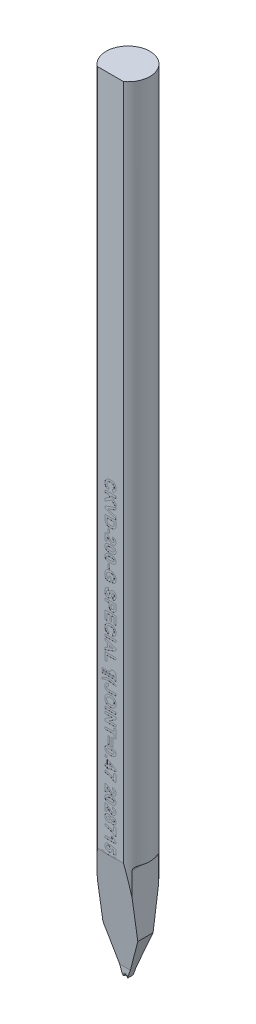
from build123d import *

# Parameters (mm, degrees)
SKETCH_TL_CUTTING_R       = 1.99771
TL_CUTTING_DEPTH          = 72.009
SKETCH_TDF_GRINDING_W     = 4.01542
SKETCH_TDF_GRINDING_H     = 4.01542
TDF_GRINDING_DEPTH        = 73.064400167
SKETCH_ENGRAVING_W        = 0.166666667
SKETCH_ENGRAVING_H        = 0.371794872
SKETCH_ENGRAVING_W_2      = 1
SKETCH_ENGRAVING_H_2      = 0.192307693
SKETCH_ENGRAVING_H_3      = 0.192307692
SKETCH_ENGRAVING_H_4      = 0.692307692
SKETCH_ENGRAVING_W_3      = 0.192307692
ENGRAVING_DEPTH           = 0.005
VW_VR_GRINDING_DEPTH      = 2.00771
VW_VR_GRINDING_DEPTH_BACK = 2.00771
ISA_GRINDING_DEPTH        = 2.00771
ISA_GRINDING_DEPTH_BACK   = 2.00771
PRE_FRX_BRX_DEPTH         = 2.00771
PRE_FRX_BRX_DEPTH_BACK    = 2.00771
SKETCH_PRE_FRX_BRX_W      = 1.7372
SKETCH_PRE_FRX_BRX_H      = 0.78994
FR_EDM_R                  = 0.20066
BR_EDM_R                  = 0.09906
FA_BA_GRINDING_DEPTH      = 2.00771
FA_BA_GRINDING_DEPTH_BACK = 2.00771


with BuildPart() as part:
    # sketch_TL_cutting → TL_cutting (new body)
    with BuildSketch(Plane(origin=(0, 0, 0), x_dir=(1, 0, 0), z_dir=(0, 1, 0))):
        Circle(SKETCH_TL_CUTTING_R)
    extrude(amount=TL_CUTTING_DEPTH)

    # sketch_TDF_grinding → TDF_grinding (cut, through all)
    with BuildSketch(Plane(origin=(0, 0, 0), x_dir=(1, 0, 0), z_dir=(0, 1, 0))):
        with Locations((0, -3.60918)):
            Rectangle(SKETCH_TDF_GRINDING_W, SKETCH_TDF_GRINDING_H)
    extrude(amount=TDF_GRINDING_DEPTH, mode=Mode.SUBTRACT)

    # sketch_engraving → engraving (cut)
    # profile 1 of 38: a face of its own
    with BuildSketch(Plane.XY.offset(1.60147)):
        with BuildLine():
            Line((-0.128205128, 39.265410256), (-0.192307692, 39.073102564))
            add(Edge.make_bspline(
                [(-0.192307692, 39.073102564), (-0.204917923, 39.077009052), (-0.229612721, 39.084659184), (-0.2649877, 39.098737804), (-0.297871332, 39.114732008), (-0.328259475, 39.132559875), (-0.356049464, 39.152295258), (-0.381471598, 39.173789244), (-0.404368127, 39.197253424), (-0.424673345, 39.222670624), (-0.442633936, 39.249763711), (-0.457816548, 39.278856053), (-0.470893242, 39.30951117), (-0.481488041, 39.342040557), (-0.489972889, 39.376228151), (-0.495577171, 39.412234413), (-0.499377062, 39.449890896), (-0.499789062, 39.475603283), (-0.5, 39.488767628)],
                knots=[0, 0, 0, 0, 1.126670901, 2.206376047, 3.246533763, 4.245677351, 5.210506282, 6.152793389, 7.083980095, 8.004497442, 8.926231833, 9.854395169, 10.801995143, 11.768203916, 12.771938831, 13.805609698, 14.87650608, 16, 16, 16, 16], degree=3))
            add(Edge.make_bspline(
                [(-0.5, 39.488767628), (-0.499663994, 39.505016309), (-0.499003061, 39.536977949), (-0.492350465, 39.583719052), (-0.481969511, 39.628260328), (-0.467601869, 39.670669613), (-0.448555271, 39.710648786), (-0.42571373, 39.748573108), (-0.398318662, 39.784009391), (-0.367249987, 39.817150716), (-0.332452821, 39.847279196), (-0.294134751, 39.873272297), (-0.253074131, 39.895810491), (-0.208709772, 39.913736594), (-0.161353037, 39.927821791), (-0.110975156, 39.937668328), (-0.057578507, 39.943834942), (-0.020984357, 39.944537083), (-0.002203526, 39.944897436)],
                knots=[0, 0, 0, 0, 1.025134988, 2.016471176, 2.973446247, 3.909197306, 4.836872559, 5.763618465, 6.698581235, 7.658772073, 8.627106982, 9.597494692, 10.576422683, 11.578339294, 12.6118974, 13.690673505, 14.814808564, 16, 16, 16, 16], degree=3))
            add(Edge.make_bspline(
                [(-0.002203526, 39.944897436), (0.017576475, 39.9445292), (0.056163648, 39.943810839), (0.112313555, 39.937762878), (0.165084042, 39.927716768), (0.214577853, 39.914140058), (0.260470573, 39.895929249), (0.303160692, 39.874073909), (0.342311169, 39.847956152), (0.377833814, 39.818031091), (0.409480853, 39.784897852), (0.437377469, 39.749193428), (0.460593243, 39.710691041), (0.479896446, 39.669867336), (0.494630503, 39.626423397), (0.505304611, 39.580476602), (0.511505561, 39.532006054), (0.512376199, 39.49886808), (0.512820513, 39.481956731)],
                knots=[0, 0, 0, 0, 1.212773307, 2.365899439, 3.458117515, 4.504331001, 5.50806732, 6.480562534, 7.440239902, 8.387651817, 9.323121479, 10.245404239, 11.160468186, 12.07454208, 13.009500751, 13.96802424, 14.963018902, 16, 16, 16, 16], degree=3))
            add(Edge.make_bspline(
                [(0.512820513, 39.481956731), (0.512448361, 39.467187276), (0.511718707, 39.438229796), (0.506761415, 39.395824506), (0.498061698, 39.355636158), (0.486319015, 39.317447521), (0.470821797, 39.281475987), (0.451884357, 39.247657111), (0.429606892, 39.215874651), (0.412205553, 39.196725065), (0.403445513, 39.187084936)],
                knots=[0, 0, 0, 0, 1.098510076, 2.153775193, 3.169777012, 4.153122333, 5.120892526, 6.076995459, 7.031936742, 8, 8, 8, 8], degree=3))
            add(Edge.make_bspline(
                [(0.403445513, 39.187084936), (0.39787141, 39.181497644), (0.386592274, 39.170191818), (0.367549896, 39.155095368), (0.347050772, 39.140782058), (0.324745215, 39.127479068), (0.30046466, 39.115606849), (0.274581981, 39.104594097), (0.246997406, 39.094455069), (0.227800247, 39.088816604), (0.217948718, 39.085923077)],
                knots=[0, 0, 0, 0, 0.885292881, 1.791380647, 2.722937556, 3.69093542, 4.703306561, 5.754477758, 6.847650944, 8, 8, 8, 8], degree=3))
            Line((0.217948718, 39.085923077), (0.179487179, 39.278230769))
            add(Edge.make_bspline(
                [(0.179487179, 39.278230769), (0.1857949, 39.279865288), (0.198219456, 39.283084861), (0.21607256, 39.28959955), (0.233014714, 39.297071208), (0.248625569, 39.3063361), (0.263619506, 39.316162074), (0.277222328, 39.327824773), (0.290109132, 39.340329754), (0.301694454, 39.354218861), (0.312145605, 39.369093589), (0.321339918, 39.384803983), (0.329014435, 39.401388478), (0.335156827, 39.418721754), (0.340319842, 39.436745702), (0.34350638, 39.455632147), (0.345953545, 39.475215752), (0.3460861, 39.488558875), (0.346153846, 39.495378205)],
                knots=[0, 0, 0, 0, 1.051114734, 2.070420253, 3.064047898, 4.034553068, 4.997066449, 5.953344811, 6.921213386, 7.892675544, 8.867420182, 9.852654213, 10.826683617, 11.811917648, 12.818610352, 13.848120519, 14.900229319, 16, 16, 16, 16], degree=3))
            add(Edge.make_bspline(
                [(0.346153846, 39.495378205), (0.345958725, 39.504742256), (0.345576529, 39.52308423), (0.341532101, 39.54981448), (0.335695112, 39.575255692), (0.326982094, 39.59931706), (0.315677399, 39.621931698), (0.302244603, 39.643428905), (0.286035184, 39.663260806), (0.26758257, 39.681899764), (0.246135655, 39.698607721), (0.221779967, 39.713310652), (0.194212535, 39.725504121), (0.163711493, 39.735404409), (0.130202077, 39.743196736), (0.093641969, 39.748761162), (0.054005962, 39.751838434), (0.026581025, 39.752333903), (0.012419872, 39.752589744)],
                knots=[0, 0, 0, 0, 0.93816214, 1.837638998, 2.704791736, 3.551915875, 4.396257554, 5.235807848, 6.087970119, 6.959042444, 7.860386085, 8.80649345, 9.804409709, 10.875695391, 12.017327537, 13.250155505, 14.580089023, 16, 16, 16, 16], degree=3))
            add(Edge.make_bspline(
                [(0.012419872, 39.752589744), (-0.002609028, 39.752336423), (-0.031567402, 39.751848312), (-0.073337178, 39.748771685), (-0.111754322, 39.743171705), (-0.14688701, 39.735482849), (-0.178713725, 39.725532973), (-0.207179389, 39.713359106), (-0.23231734, 39.698886701), (-0.254110839, 39.682138275), (-0.272831387, 39.663537256), (-0.288926796, 39.643587439), (-0.302688307, 39.622406524), (-0.314010391, 39.599867053), (-0.322575422, 39.575883298), (-0.328786932, 39.550652371), (-0.332735688, 39.524081695), (-0.333131326, 39.505875799), (-0.333333333, 39.496580128)],
                knots=[0, 0, 0, 0, 1.475208372, 2.842499301, 4.107722225, 5.282836115, 6.369007568, 7.375918121, 8.315702116, 9.208439171, 10.065831443, 10.90006451, 11.71996243, 12.54067204, 13.369972975, 14.214060185, 15.088124569, 16, 16, 16, 16], degree=3))
            add(Edge.make_bspline(
                [(-0.333333333, 39.496580128), (-0.333161634, 39.489697953), (-0.332824013, 39.476165176), (-0.330681155, 39.456162689), (-0.326591822, 39.43696438), (-0.321184418, 39.418476281), (-0.314399721, 39.400626559), (-0.305696319, 39.38368748), (-0.295693052, 39.367325777), (-0.283969989, 39.35188094), (-0.270808612, 39.337146156), (-0.255597341, 39.323707159), (-0.238701667, 39.311241373), (-0.220008678, 39.299906947), (-0.199678377, 39.28932516), (-0.177394008, 39.280322121), (-0.153515697, 39.271934984), (-0.136789345, 39.267623153), (-0.128205128, 39.265410256)],
                knots=[0, 0, 0, 0, 0.980177776, 1.927374078, 2.859849964, 3.771585772, 4.668674471, 5.574490016, 6.479656464, 7.396337719, 8.332153134, 9.288470092, 10.28125149, 11.318486971, 12.398724812, 13.541284404, 14.738150009, 16, 16, 16, 16], degree=3))
        make_face()
    # profile 2 of 38: a face of its own
    with BuildSketch(Plane.XY.offset(1.60147)):
        Polygon((-0.5, 38.906435897), (0.5, 38.906435897), (0.5, 38.714128205), (0.052283654, 38.714128205), (0.5, 38.292453526), (0.5, 38.028230769), (0.11338141, 38.408038462), (-0.5, 38.015410256), (-0.5, 38.271620192), (-0.035456731, 38.553871795), (-0.198517628, 38.714128205), (-0.5, 38.714128205), align=None)
    # profile 3 of 38: a face of its own
    with BuildSketch(Plane.XY.offset(1.60147)):
        Polygon((-0.5, 37.639208333), (0.5, 38.009), (0.5, 37.805875), (-0.243589744, 37.541051282), (0.5, 37.277229167), (0.5, 37.073102564), (-0.5, 37.441491987), align=None)
    # profile 4 of 38: a face of its own
    with BuildSketch(Plane.XY.offset(1.60147)):
        with BuildLine():
            Line((0.5, 36.983358974), (0.5, 36.616572115))
            add(Edge.make_bspline(
                [(0.5, 36.616572115), (0.500005193, 36.606554571), (0.500015306, 36.587048084), (0.498840892, 36.558739066), (0.497659587, 36.532266494), (0.495294873, 36.507706352), (0.492816233, 36.484973432), (0.489678088, 36.464026942), (0.485656212, 36.444999202), (0.482484481, 36.433000319), (0.480969551, 36.427269231)],
                knots=[0, 0, 0, 0, 1.259756885, 2.453039283, 3.563158368, 4.591894114, 5.55549294, 6.43918076, 7.254497783, 8, 8, 8, 8], degree=3))
            add(Edge.make_bspline(
                [(0.480969551, 36.427269231), (0.478637325, 36.420100254), (0.474014881, 36.405891431), (0.465827813, 36.385038378), (0.455960096, 36.365204479), (0.445111978, 36.345929819), (0.432903728, 36.327657553), (0.419595761, 36.309942873), (0.404753223, 36.293309803), (0.383633179, 36.27177514), (0.35420815, 36.247350255), (0.315375005, 36.22151972), (0.272594656, 36.199782014), (0.234409605, 36.184590641), (0.20183843, 36.174546542), (0.175754603, 36.167978141), (0.148301213, 36.162306468), (0.119383738, 36.158056292), (0.08913491, 36.154394906), (0.057465542, 36.151767238), (0.024383276, 36.15046625), (0.001870575, 36.150174494), (-0.009615385, 36.150025641)],
                knots=[0, 0, 0, 0, 0.745431882, 1.477436776, 2.212739876, 2.934276521, 3.663147754, 4.384200836, 5.123377481, 5.865761747, 7.365547505, 8.894711587, 10.468722596, 12.101948761, 12.951987285, 13.837595333, 14.760899389, 15.722756883, 16.726861385, 17.773652936, 18.864119771, 20, 20, 20, 20], degree=3))
            add(Edge.make_bspline(
                [(-0.009615385, 36.150025641), (-0.0294616, 36.150417046), (-0.067834928, 36.15117384), (-0.123301552, 36.156771211), (-0.17465514, 36.166066648), (-0.206804138, 36.175777075), (-0.222355769, 36.180474359)],
                knots=[0, 0, 0, 0, 1.103491527, 2.133638164, 3.0971734, 4, 4, 4, 4], degree=3))
            add(Edge.make_bspline(
                [(-0.222355769, 36.180474359), (-0.231274521, 36.183648003), (-0.248819098, 36.189891057), (-0.274127236, 36.200815932), (-0.298211673, 36.212620337), (-0.321053432, 36.225402184), (-0.342549771, 36.239226052), (-0.362636394, 36.254143645), (-0.381577746, 36.269923731), (-0.393236239, 36.28135549), (-0.399038462, 36.287044872)],
                knots=[0, 0, 0, 0, 1.090884612, 2.145940218, 3.175104604, 4.181306866, 5.161203701, 6.118658341, 7.063689906, 8, 8, 8, 8], degree=3))
            add(Edge.make_bspline(
                [(-0.399038462, 36.287044872), (-0.407300305, 36.296331145), (-0.424264154, 36.315398431), (-0.445652736, 36.34874995), (-0.464086504, 36.386625276), (-0.473760833, 36.413939168), (-0.478766026, 36.428070513)],
                knots=[0, 0, 0, 0, 0.912008655, 1.872605891, 2.89935344, 4, 4, 4, 4], degree=3))
            add(Edge.make_bspline(
                [(-0.478766026, 36.428070513), (-0.4805228, 36.433790486), (-0.484168894, 36.445661996), (-0.488062998, 36.464485444), (-0.492165475, 36.484579947), (-0.49463687, 36.506177223), (-0.497243066, 36.529053081), (-0.498706299, 36.553389822), (-0.49974511, 36.579103081), (-0.499913777, 36.596739175), (-0.5, 36.605754808)],
                knots=[0, 0, 0, 0, 0.799129865, 1.658552685, 2.566799617, 3.538529252, 4.561352959, 5.643373779, 6.795284424, 8, 8, 8, 8], degree=3))
            Line((-0.5, 36.605754808), (-0.5, 36.983358974))
            Line((-0.5, 36.983358974), (0.5, 36.983358974))
        make_face()
        with BuildLine():
            Line((0.333333333, 36.791051282), (-0.333333333, 36.791051282))
            Line((-0.333333333, 36.791051282), (-0.333333333, 36.632798077))
            add(Edge.make_bspline(
                [(-0.333333333, 36.632798077), (-0.333276671, 36.62565336), (-0.333167574, 36.611897049), (-0.332847006, 36.591991316), (-0.331979167, 36.573698115), (-0.331080228, 36.556921614), (-0.329595022, 36.54170549), (-0.328134266, 36.527983535), (-0.326090699, 36.515832132), (-0.324477534, 36.508327127), (-0.323717949, 36.504793269)],
                knots=[0, 0, 0, 0, 1.333384787, 2.567275092, 3.714769766, 4.750907381, 5.701951617, 6.567520054, 7.325492842, 8, 8, 8, 8], degree=3))
            add(Edge.make_bspline(
                [(-0.323717949, 36.504793269), (-0.321509316, 36.496516575), (-0.317207482, 36.480395757), (-0.307617456, 36.457760499), (-0.296048139, 36.437278507), (-0.282136533, 36.41860677), (-0.26455548, 36.40177967), (-0.242070693, 36.387415683), (-0.215254411, 36.374122192), (-0.189584523, 36.365018806), (-0.16665678, 36.358484413), (-0.147412959, 36.354061165), (-0.126593091, 36.350565591), (-0.104279343, 36.347558942), (-0.080500412, 36.345129499), (-0.055170426, 36.343617784), (-0.028320392, 36.342586029), (-0.009883527, 36.342419161), (-0.000400641, 36.342333333)],
                knots=[0, 0, 0, 0, 1.038686998, 2.023088296, 2.974059649, 3.888265163, 4.839857954, 5.909819677, 7.113156087, 8.466843969, 9.20827164, 10.006482943, 10.861893492, 11.769681931, 12.739021491, 13.762258324, 14.849031541, 16, 16, 16, 16], degree=3))
            add(Edge.make_bspline(
                [(-0.000400641, 36.342333333), (0.009082275, 36.3424185), (0.027452469, 36.342583485), (0.054102292, 36.343613664), (0.079033415, 36.345116863), (0.102276578, 36.347563691), (0.123864169, 36.350523456), (0.143813574, 36.354060891), (0.161996804, 36.358454423), (0.183589283, 36.365007511), (0.207947697, 36.374844996), (0.23429421, 36.388671199), (0.2571147, 36.404936402), (0.276689574, 36.423291558), (0.29287817, 36.444378569), (0.306422028, 36.467749371), (0.316938162, 36.493880279), (0.321416742, 36.512469318), (0.323717949, 36.522020833)],
                knots=[0, 0, 0, 0, 1.118059345, 2.165891593, 3.144157881, 4.062285166, 4.920717571, 5.712910489, 6.449981617, 7.12489426, 8.371943983, 9.541298068, 10.624898781, 11.666293176, 12.69306237, 13.747704633, 14.842713931, 16, 16, 16, 16], degree=3))
            add(Edge.make_bspline(
                [(0.323717949, 36.522020833), (0.324486218, 36.526155143), (0.326177652, 36.535257311), (0.328151987, 36.550361571), (0.329628909, 36.568148179), (0.331099472, 36.588577116), (0.331977905, 36.611627064), (0.332859431, 36.637332571), (0.333166326, 36.665716851), (0.333276065, 36.685549207), (0.333333333, 36.695899038)],
                knots=[0, 0, 0, 0, 0.578739524, 1.274162912, 2.095457587, 3.035141998, 4.093102578, 5.270121571, 6.575369351, 8, 8, 8, 8], degree=3))
            Line((0.333333333, 36.695899038), (0.333333333, 36.791051282))
        make_face(mode=Mode.SUBTRACT)
    # profile 5 of 38: a face of its own
    with BuildSketch(Plane.XY.offset(1.60147)):
        with Locations((-0.147435898, 35.823102564)):
            Rectangle(SKETCH_ENGRAVING_W, SKETCH_ENGRAVING_H)
    # profile 6 of 38: a face of its own
    with BuildSketch(Plane.XY.offset(1.60147)):
        with BuildLine():
            Line((-0.307692308, 34.91925641), (-0.5, 34.91925641))
            Line((-0.5, 34.91925641), (-0.5, 35.573102564))
            add(Edge.make_bspline(
                [(-0.5, 35.573102564), (-0.483565984, 35.5708845), (-0.450707166, 35.566449615), (-0.402658764, 35.552822822), (-0.355879438, 35.534298094), (-0.317848438, 35.514392572), (-0.286923212, 35.49503663), (-0.262057708, 35.476824911), (-0.235074392, 35.455795206), (-0.206603976, 35.431244574), (-0.176093602, 35.403785521), (-0.14381225, 35.373076523), (-0.109876761, 35.339020728), (-0.086834533, 35.315059651), (-0.074919872, 35.302669872)],
                knots=[0, 0, 0, 0, 1.156381417, 2.312114436, 3.475445649, 4.663832578, 5.302694182, 6.020660876, 6.814180865, 7.69035705, 8.644181007, 9.679458435, 10.800095821, 12, 12, 12, 12], degree=3))
            add(Edge.make_bspline(
                [(-0.074919872, 35.302669872), (-0.065377972, 35.292780973), (-0.047213006, 35.273955421), (-0.021173696, 35.247176806), (0.002635387, 35.223569628), (0.024062885, 35.202997359), (0.042867348, 35.185186177), (0.059484162, 35.170614894), (0.073602098, 35.158829106), (0.082565079, 35.152452026), (0.086538462, 35.149625)],
                knots=[0, 0, 0, 0, 1.480739016, 2.818890974, 4.024686436, 5.093297083, 6.019761393, 6.815071481, 7.474708909, 8, 8, 8, 8], degree=3))
            add(Edge.make_bspline(
                [(0.086538462, 35.149625), (0.096145343, 35.143806108), (0.114654059, 35.132595371), (0.143960972, 35.120736299), (0.173010268, 35.112996232), (0.192528875, 35.112036075), (0.202123397, 35.111564103)],
                knots=[0, 0, 0, 0, 1.091434863, 2.102769638, 3.067401785, 4, 4, 4, 4], degree=3))
            add(Edge.make_bspline(
                [(0.202123397, 35.111564103), (0.212103794, 35.111917564), (0.230985925, 35.112586284), (0.257559137, 35.118379288), (0.280564781, 35.128207351), (0.299731306, 35.142220562), (0.314878913, 35.159869559), (0.325894297, 35.18062659), (0.332110851, 35.204564417), (0.33291372, 35.22137036), (0.333333333, 35.230153846)],
                knots=[0, 0, 0, 0, 1.192552326, 2.256215989, 3.232470907, 4.163657734, 5.069678789, 5.991331675, 6.950186205, 8, 8, 8, 8], degree=3))
            add(Edge.make_bspline(
                [(0.333333333, 35.230153846), (0.332938162, 35.238876083), (0.332174776, 35.255725562), (0.325505939, 35.279672328), (0.313961482, 35.300621328), (0.30080546, 35.3155507), (0.288012183, 35.325636199), (0.276863686, 35.332508106), (0.264195574, 35.338431153), (0.250150469, 35.343679467), (0.23456747, 35.347825042), (0.217565257, 35.35116363), (0.199052334, 35.35385405), (0.186173423, 35.354709651), (0.179487179, 35.355153846)],
                knots=[0, 0, 0, 0, 1.402788338, 2.709884207, 3.961032948, 5.225417836, 5.883680772, 6.578928686, 7.329201998, 8.132101139, 8.990263233, 9.922304639, 10.921339128, 12, 12, 12, 12], degree=3))
            Line((0.179487179, 35.355153846), (0.198317308, 35.547461538))
            add(Edge.make_bspline(
                [(0.198317308, 35.547461538), (0.211300501, 35.545915414), (0.236472838, 35.542917727), (0.272628993, 35.535436947), (0.305984679, 35.525962817), (0.336477992, 35.514043673), (0.364302841, 35.500172147), (0.389041697, 35.483640677), (0.410968596, 35.465026889), (0.430071868, 35.444314696), (0.446412285, 35.421635774), (0.460998615, 35.397838314), (0.472964043, 35.372457248), (0.482825353, 35.345772022), (0.490706433, 35.317794696), (0.495917297, 35.288395871), (0.499582638, 35.257756985), (0.499858783, 35.236842754), (0.5, 35.226147436)],
                knots=[0, 0, 0, 0, 1.270971563, 2.464210789, 3.586263665, 4.638946707, 5.643716971, 6.603612468, 7.52484387, 8.434700188, 9.336036235, 10.239171475, 11.145359471, 12.059630629, 13.003312604, 13.96741569, 14.960557767, 16, 16, 16, 16], degree=3))
            add(Edge.make_bspline(
                [(0.5, 35.226147436), (0.499776553, 35.214520228), (0.499341362, 35.191874782), (0.495746905, 35.158816703), (0.489481026, 35.127760072), (0.48117587, 35.098437686), (0.470106061, 35.071135423), (0.456633778, 35.045631801), (0.440545401, 35.022185967), (0.422288069, 35.000772647), (0.402418882, 34.98155341), (0.380890105, 34.965099126), (0.358545244, 34.950653325), (0.334632005, 34.939313401), (0.309750235, 34.930074415), (0.283460918, 34.9241297), (0.256153456, 34.919782639), (0.237464899, 34.91943376), (0.227964744, 34.91925641)],
                knots=[0, 0, 0, 0, 1.21054264, 2.357683783, 3.456743179, 4.506371233, 5.526380269, 6.518616322, 7.504105716, 8.480749833, 9.444588379, 10.376395364, 11.298423092, 12.209585683, 13.126776925, 14.056012185, 15.011791738, 16, 16, 16, 16], degree=3))
            add(Edge.make_bspline(
                [(0.227964744, 34.91925641), (0.217064496, 34.919501523), (0.195440077, 34.919987788), (0.163469012, 34.924628232), (0.132249846, 34.931752879), (0.101610438, 34.942160599), (0.071147148, 34.955832869), (0.040108962, 34.972570405), (0.008522341, 34.99284347), (-0.012178306, 35.008269216), (-0.022836538, 35.016211538)],
                knots=[0, 0, 0, 0, 0.953498, 1.891593709, 2.82157134, 3.753035249, 4.718494268, 5.740911752, 6.836853288, 8, 8, 8, 8], degree=3))
            add(Edge.make_bspline(
                [(-0.022836538, 35.016211538), (-0.026670091, 35.019250283), (-0.034880672, 35.025758569), (-0.047378398, 35.036864169), (-0.061345658, 35.049468652), (-0.076193638, 35.064149991), (-0.092563957, 35.08036898), (-0.109838998, 35.098555378), (-0.128325502, 35.118525449), (-0.147648705, 35.139476619), (-0.166391428, 35.160637623), (-0.184247543, 35.179983916), (-0.20029985, 35.197316722), (-0.214732899, 35.212468686), (-0.227268639, 35.225705936), (-0.238167377, 35.236775957), (-0.247265417, 35.245857085), (-0.26144337, 35.258373362), (-0.280620183, 35.274297881), (-0.298943771, 35.285501724), (-0.307692308, 35.290850962)],
                knots=[0, 0, 0, 0, 0.665546509, 1.425446362, 2.274432636, 3.225431318, 4.2662943, 5.410247296, 6.638261485, 7.969509561, 9.288545809, 10.484715594, 11.551975365, 12.503234464, 13.332293902, 14.032657109, 14.617374704, 15.080693821, 16.606187002, 18, 18, 18, 18], degree=3))
            Line((-0.307692308, 35.290850962), (-0.307692308, 34.91925641))
        make_face()
    # profile 7 of 38: a face of its own
    with BuildSketch(Plane.XY.offset(1.60147)):
        with BuildLine():
            add(Edge.make_bspline(
                [(0.5, 34.476948718), (0.49971384, 34.465044998), (0.499156721, 34.441869821), (0.494192381, 34.408107508), (0.486315205, 34.376354925), (0.474936732, 34.346605943), (0.460535804, 34.318709267), (0.442472771, 34.293057415), (0.421624591, 34.26905643), (0.405435577, 34.255200797), (0.397235577, 34.248182692)],
                knots=[0, 0, 0, 0, 1.098626248, 2.138899374, 3.143835643, 4.113754749, 5.073488057, 6.034745239, 7.004566348, 8, 8, 8, 8], degree=3))
            add(Edge.make_bspline(
                [(0.397235577, 34.248182692), (0.392013767, 34.244167993), (0.381356969, 34.235974695), (0.364136726, 34.22494029), (0.345869985, 34.214331685), (0.326116385, 34.205073442), (0.305221356, 34.196200078), (0.283126793, 34.188009313), (0.259707844, 34.18077695), (0.235071142, 34.174472124), (0.209179241, 34.168578627), (0.181968999, 34.163641398), (0.15350924, 34.159415972), (0.123831018, 34.156120738), (0.092992495, 34.153166339), (0.060842825, 34.151549757), (0.027454838, 34.150225267), (0.004742429, 34.150092949), (-0.006810897, 34.150025641)],
                knots=[0, 0, 0, 0, 0.746775751, 1.524038446, 2.317840886, 3.141016509, 3.996283186, 4.892488336, 5.812382473, 6.774967264, 7.776368117, 8.823659909, 9.910833035, 11.039122168, 12.210293276, 13.424012874, 14.68964937, 16, 16, 16, 16], degree=3))
            add(Edge.make_bspline(
                [(-0.006810897, 34.150025641), (-0.01836425, 34.150091934), (-0.041009977, 34.150221876), (-0.074330982, 34.151554693), (-0.106413621, 34.153167781), (-0.13725379, 34.156113853), (-0.166926114, 34.159440728), (-0.195353975, 34.163546272), (-0.22243919, 34.168864764), (-0.248289812, 34.174671418), (-0.27303117, 34.180936077), (-0.296407841, 34.1884899), (-0.318777777, 34.196350303), (-0.339699687, 34.205429898), (-0.359477735, 34.215020372), (-0.377930928, 34.225471112), (-0.395257891, 34.236628726), (-0.40597091, 34.244901289), (-0.411258013, 34.248983974)],
                knots=[0, 0, 0, 0, 1.308411734, 2.564617834, 3.776541518, 4.94597967, 6.0725993, 7.15816376, 8.197872509, 9.197791611, 10.158952087, 11.086962723, 11.979249638, 12.843171697, 13.668427753, 14.467630577, 15.243743175, 16, 16, 16, 16], degree=3))
            add(Edge.make_bspline(
                [(-0.411258013, 34.248983974), (-0.419387722, 34.255937875), (-0.435436162, 34.269665209), (-0.456111536, 34.293400465), (-0.473801555, 34.3190109), (-0.487914093, 34.346857064), (-0.499368982, 34.376461236), (-0.506993451, 34.408265546), (-0.511967929, 34.441935616), (-0.512532265, 34.465111213), (-0.512820513, 34.476948718)],
                knots=[0, 0, 0, 0, 0.991667276, 1.957599061, 2.911530233, 3.873218945, 4.847995157, 5.850445929, 6.902062539, 8, 8, 8, 8], degree=3))
            add(Edge.make_bspline(
                [(-0.512820513, 34.476948718), (-0.512476011, 34.488921133), (-0.511800941, 34.512381702), (-0.506449472, 34.546635149), (-0.497876451, 34.579194622), (-0.485636462, 34.609943234), (-0.469774335, 34.638836989), (-0.45076002, 34.666101616), (-0.427732542, 34.691143948), (-0.40629523, 34.710749361), (-0.386925042, 34.725092741), (-0.37086259, 34.735209036), (-0.353675124, 34.744985358), (-0.33482528, 34.753423499), (-0.314870578, 34.761748475), (-0.293380967, 34.769121787), (-0.270541238, 34.775626959), (-0.246455682, 34.781734901), (-0.220958398, 34.786828025), (-0.194124629, 34.791512952), (-0.165840258, 34.795204927), (-0.136262825, 34.798478243), (-0.105322509, 34.800782844), (-0.073069943, 34.802654475), (-0.039401887, 34.803592969), (-0.01649349, 34.803777608), (-0.004807692, 34.803871795)],
                knots=[0, 0, 0, 0, 1.257818097, 2.464759732, 3.634271214, 4.790227596, 5.933394726, 7.09190477, 8.274482889, 9.50191983, 10.139172818, 10.805000628, 11.49619854, 12.215266328, 12.973768034, 13.768328009, 14.601232062, 15.469317089, 16.379095881, 17.333267023, 18.331755967, 19.376479622, 20.460535752, 21.592206075, 22.771760786, 24, 24, 24, 24], degree=3))
            add(Edge.make_bspline(
                [(-0.004807692, 34.803871795), (0.006678925, 34.803806), (0.02919122, 34.803677052), (0.062378132, 34.802334948), (0.094328674, 34.800741634), (0.12509981, 34.79776902), (0.154640959, 34.794469515), (0.183004063, 34.790356894), (0.209982531, 34.784938814), (0.235876189, 34.779589743), (0.260431507, 34.772849782), (0.2837906, 34.765424475), (0.306110518, 34.757590136), (0.326924245, 34.748417854), (0.346659803, 34.738882898), (0.365109758, 34.728424838), (0.382437536, 34.717269066), (0.39315045, 34.708996265), (0.3984375, 34.704913462)],
                knots=[0, 0, 0, 0, 1.304443357, 2.556541329, 3.771813033, 4.936929721, 6.066661712, 7.147723817, 8.190304831, 9.191350322, 10.149780912, 11.080355239, 11.975107155, 12.834450748, 13.66198663, 14.463397305, 15.241653965, 16, 16, 16, 16], degree=3))
            add(Edge.make_bspline(
                [(0.3984375, 34.704913462), (0.406566428, 34.697959179), (0.422613323, 34.684231089), (0.443299998, 34.660501361), (0.460913987, 34.634919209), (0.475197493, 34.607154301), (0.486497465, 34.577482107), (0.494183265, 34.545636121), (0.499144648, 34.511960686), (0.499710816, 34.488785839), (0.5, 34.476948718)],
                knots=[0, 0, 0, 0, 0.991631672, 1.957528776, 2.911425699, 3.867574088, 4.848108326, 5.850523106, 6.902101959, 8, 8, 8, 8], degree=3))
        make_face()
        with BuildLine():
            add(Edge.make_bspline(
                [(0.333333333, 34.476948718), (0.333068079, 34.483116684), (0.332548986, 34.495187158), (0.328316127, 34.512742094), (0.321759633, 34.529323165), (0.312130705, 34.544881206), (0.299093083, 34.55928978), (0.281476094, 34.571497658), (0.259881539, 34.582051162), (0.243736, 34.587330771), (0.235176282, 34.590129808)],
                knots=[0, 0, 0, 0, 0.909107913, 1.77908945, 2.650019014, 3.530482969, 4.465025013, 5.495890128, 6.672421267, 8, 8, 8, 8], degree=3))
            add(Edge.make_bspline(
                [(0.235176282, 34.590129808), (0.228718042, 34.591877997), (0.214837576, 34.595635317), (0.192206647, 34.59989972), (0.166522939, 34.603416485), (0.137792419, 34.606386038), (0.105999886, 34.608802628), (0.071125109, 34.610290848), (0.033192525, 34.611319478), (0.006878451, 34.611480391), (-0.006810897, 34.611564103)],
                knots=[0, 0, 0, 0, 0.658986521, 1.416336438, 2.266694271, 3.212608458, 4.261595115, 5.407496572, 6.651304179, 8, 8, 8, 8], degree=3))
            add(Edge.make_bspline(
                [(-0.006810897, 34.611564103), (-0.020433943, 34.611573117), (-0.046549094, 34.611590397), (-0.084006477, 34.610416163), (-0.118154033, 34.60924872), (-0.148991056, 34.606879061), (-0.176626244, 34.604540892), (-0.200847568, 34.601003343), (-0.221857789, 34.597450608), (-0.244486895, 34.591417153), (-0.268257705, 34.583101394), (-0.292448985, 34.571872977), (-0.311537375, 34.559207058), (-0.325415776, 34.544675587), (-0.334597404, 34.528930329), (-0.341538269, 34.512626395), (-0.345246665, 34.495074555), (-0.345848983, 34.483040013), (-0.346153846, 34.476948718)],
                knots=[0, 0, 0, 0, 1.613038927, 3.092168624, 4.43749063, 5.658264602, 6.75425577, 7.720394221, 8.556328411, 9.275513998, 10.490872946, 11.534172084, 12.42681833, 13.187531851, 13.88996177, 14.574222125, 15.278341114, 16, 16, 16, 16], degree=3))
            add(Edge.make_bspline(
                [(-0.346153846, 34.476948718), (-0.345874419, 34.47085088), (-0.345321688, 34.458788799), (-0.341225408, 34.441256833), (-0.334465655, 34.424699336), (-0.325029126, 34.409036493), (-0.311901617, 34.39461441), (-0.294300445, 34.382397614), (-0.272700888, 34.37184693), (-0.25655611, 34.366566893), (-0.247996795, 34.363767628)],
                knots=[0, 0, 0, 0, 0.899391665, 1.779078861, 2.640979247, 3.529945348, 4.464599804, 5.495588918, 6.672261578, 8, 8, 8, 8], degree=3))
            add(Edge.make_bspline(
                [(-0.247996795, 34.363767628), (-0.241538043, 34.362021968), (-0.227719754, 34.358287186), (-0.205229709, 34.353992396), (-0.179679092, 34.35046611), (-0.151079269, 34.347524791), (-0.11935541, 34.345084431), (-0.084546407, 34.343608845), (-0.046680798, 34.342579247), (-0.020433482, 34.342417356), (-0.006810897, 34.342333333)],
                knots=[0, 0, 0, 0, 0.66114423, 1.414496391, 2.261103113, 3.210114492, 4.255954433, 5.405607896, 6.653488082, 8, 8, 8, 8], degree=3))
            add(Edge.make_bspline(
                [(-0.006810897, 34.342333333), (0.006810741, 34.342447109), (0.032921137, 34.342665199), (0.070464093, 34.343292091), (0.104645163, 34.345047006), (0.13553417, 34.346803226), (0.163028833, 34.349768631), (0.187277888, 34.352711537), (0.208178651, 34.356783667), (0.23096624, 34.362375697), (0.254848985, 34.37071368), (0.278913284, 34.38228584), (0.298191428, 34.39472291), (0.312146257, 34.409229879), (0.321683592, 34.424948044), (0.328364426, 34.441400374), (0.332523972, 34.458849531), (0.333060584, 34.47084941), (0.333333333, 34.476948718)],
                knots=[0, 0, 0, 0, 1.611458614, 3.088895909, 4.441089836, 5.660086535, 6.747875232, 7.711965119, 8.548505902, 9.26500436, 10.486583113, 11.532259092, 12.419544583, 13.184925779, 13.890764661, 14.581638641, 15.279074115, 16, 16, 16, 16], degree=3))
        make_face(mode=Mode.SUBTRACT)
    # profile 8 of 38: a face of its own
    with BuildSketch(Plane.XY.offset(1.60147)):
        with BuildLine():
            add(Edge.make_bspline(
                [(0.5, 33.707717949), (0.49971384, 33.695814229), (0.499156721, 33.672639051), (0.494192381, 33.638876739), (0.486315205, 33.607124156), (0.474936732, 33.577375173), (0.460535804, 33.549478497), (0.442472771, 33.523826646), (0.421624591, 33.499825661), (0.405435577, 33.485970028), (0.397235577, 33.478951923)],
                knots=[0, 0, 0, 0, 1.098626248, 2.138899374, 3.143835643, 4.113754749, 5.073488057, 6.034745239, 7.004566348, 8, 8, 8, 8], degree=3))
            add(Edge.make_bspline(
                [(0.397235577, 33.478951923), (0.392013767, 33.474937224), (0.381356969, 33.466743926), (0.364136726, 33.45570952), (0.345869985, 33.445100915), (0.326116385, 33.435842673), (0.305221356, 33.426969309), (0.283126793, 33.418778544), (0.259707844, 33.41154618), (0.235071142, 33.405241354), (0.209179241, 33.399347858), (0.181968999, 33.394410628), (0.15350924, 33.390185203), (0.123831018, 33.386889969), (0.092992495, 33.38393557), (0.060842825, 33.382318988), (0.027454838, 33.380994498), (0.004742429, 33.380862179), (-0.006810897, 33.380794872)],
                knots=[0, 0, 0, 0, 0.746775751, 1.524038446, 2.317840886, 3.141016509, 3.996283186, 4.892488336, 5.812382473, 6.774967264, 7.776368117, 8.823659909, 9.910833035, 11.039122168, 12.210293276, 13.424012874, 14.68964937, 16, 16, 16, 16], degree=3))
            add(Edge.make_bspline(
                [(-0.006810897, 33.380794872), (-0.01836425, 33.380861165), (-0.041009977, 33.380991107), (-0.074330982, 33.382323924), (-0.106413621, 33.383937012), (-0.13725379, 33.386883084), (-0.166926114, 33.390209959), (-0.195353975, 33.394315503), (-0.22243919, 33.399633995), (-0.248289812, 33.405440649), (-0.27303117, 33.411705308), (-0.296407841, 33.419259131), (-0.318777777, 33.427119533), (-0.339699687, 33.436199129), (-0.359477735, 33.445789602), (-0.377930928, 33.456240342), (-0.395257891, 33.467397957), (-0.40597091, 33.47567052), (-0.411258013, 33.479753205)],
                knots=[0, 0, 0, 0, 1.308411734, 2.564617834, 3.776541518, 4.94597967, 6.0725993, 7.15816376, 8.197872509, 9.197791611, 10.158952087, 11.086962723, 11.979249638, 12.843171697, 13.668427753, 14.467630577, 15.243743175, 16, 16, 16, 16], degree=3))
            add(Edge.make_bspline(
                [(-0.411258013, 33.479753205), (-0.419387722, 33.486707105), (-0.435436162, 33.50043444), (-0.456111536, 33.524169695), (-0.473801555, 33.549780131), (-0.487914093, 33.577626295), (-0.499368982, 33.607230467), (-0.506993451, 33.639034777), (-0.511967929, 33.672704847), (-0.512532265, 33.695880444), (-0.512820513, 33.707717949)],
                knots=[0, 0, 0, 0, 0.991667276, 1.957599061, 2.911530233, 3.873218945, 4.847995157, 5.850445929, 6.902062539, 8, 8, 8, 8], degree=3))
            add(Edge.make_bspline(
                [(-0.512820513, 33.707717949), (-0.512476011, 33.719690364), (-0.511800941, 33.743150933), (-0.506449472, 33.777404379), (-0.497876451, 33.809963853), (-0.485636462, 33.840712465), (-0.469774335, 33.86960622), (-0.45076002, 33.896870847), (-0.427732542, 33.921913179), (-0.40629523, 33.941518592), (-0.386925042, 33.955861971), (-0.37086259, 33.965978267), (-0.353675124, 33.975754589), (-0.33482528, 33.98419273), (-0.314870578, 33.992517706), (-0.293380967, 33.999891018), (-0.270541238, 34.00639619), (-0.246455682, 34.012504132), (-0.220958398, 34.017597256), (-0.194124629, 34.022282183), (-0.165840258, 34.025974157), (-0.136262825, 34.029247473), (-0.105322509, 34.031552075), (-0.073069943, 34.033423706), (-0.039401887, 34.0343622), (-0.01649349, 34.034546839), (-0.004807692, 34.034641026)],
                knots=[0, 0, 0, 0, 1.257818097, 2.464759732, 3.634271214, 4.790227596, 5.933394726, 7.09190477, 8.274482889, 9.50191983, 10.139172818, 10.805000628, 11.49619854, 12.215266328, 12.973768034, 13.768328009, 14.601232062, 15.469317089, 16.379095881, 17.333267023, 18.331755967, 19.376479622, 20.460535752, 21.592206075, 22.771760786, 24, 24, 24, 24], degree=3))
            add(Edge.make_bspline(
                [(-0.004807692, 34.034641026), (0.006678925, 34.034575231), (0.02919122, 34.034446282), (0.062378132, 34.033104179), (0.094328674, 34.031510865), (0.12509981, 34.028538251), (0.154640959, 34.025238746), (0.183004063, 34.021126125), (0.209982531, 34.015708045), (0.235876189, 34.010358974), (0.260431507, 34.003619013), (0.2837906, 33.996193706), (0.306110518, 33.988359367), (0.326924245, 33.979187084), (0.346659803, 33.969652128), (0.365109758, 33.959194069), (0.382437536, 33.948038297), (0.39315045, 33.939765495), (0.3984375, 33.935682692)],
                knots=[0, 0, 0, 0, 1.304443357, 2.556541329, 3.771813033, 4.936929721, 6.066661712, 7.147723817, 8.190304831, 9.191350322, 10.149780912, 11.080355239, 11.975107155, 12.834450748, 13.66198663, 14.463397305, 15.241653965, 16, 16, 16, 16], degree=3))
            add(Edge.make_bspline(
                [(0.3984375, 33.935682692), (0.406566428, 33.92872841), (0.422613323, 33.91500032), (0.443299998, 33.891270592), (0.460913987, 33.865688439), (0.475197493, 33.837923532), (0.486497465, 33.808251338), (0.494183265, 33.776405352), (0.499144648, 33.742729916), (0.499710816, 33.71955507), (0.5, 33.707717949)],
                knots=[0, 0, 0, 0, 0.991631672, 1.957528776, 2.911425699, 3.867574088, 4.848108326, 5.850523106, 6.902101959, 8, 8, 8, 8], degree=3))
        make_face()
        with BuildLine():
            add(Edge.make_bspline(
                [(0.333333333, 33.707717949), (0.333068079, 33.713885915), (0.332548986, 33.725956389), (0.328316127, 33.743511325), (0.321759633, 33.760092396), (0.312130705, 33.775650436), (0.299093083, 33.790059011), (0.281476094, 33.802266888), (0.259881539, 33.812820392), (0.243736, 33.818100001), (0.235176282, 33.820899038)],
                knots=[0, 0, 0, 0, 0.909107913, 1.77908945, 2.650019014, 3.530482969, 4.465025013, 5.495890128, 6.672421267, 8, 8, 8, 8], degree=3))
            add(Edge.make_bspline(
                [(0.235176282, 33.820899038), (0.228718042, 33.822647227), (0.214837576, 33.826404548), (0.192206647, 33.830668951), (0.166522939, 33.834185716), (0.137792419, 33.837155269), (0.105999886, 33.839571859), (0.071125109, 33.841060078), (0.033192525, 33.842088709), (0.006878451, 33.842249622), (-0.006810897, 33.842333333)],
                knots=[0, 0, 0, 0, 0.658986521, 1.416336438, 2.266694271, 3.212608458, 4.261595115, 5.407496572, 6.651304179, 8, 8, 8, 8], degree=3))
            add(Edge.make_bspline(
                [(-0.006810897, 33.842333333), (-0.020433943, 33.842342347), (-0.046549094, 33.842359627), (-0.084006477, 33.841185394), (-0.118154033, 33.840017951), (-0.148991056, 33.837648292), (-0.176626244, 33.835310123), (-0.200847568, 33.831772574), (-0.221857789, 33.828219839), (-0.244486895, 33.822186384), (-0.268257705, 33.813870625), (-0.292448985, 33.802642207), (-0.311537375, 33.789976289), (-0.325415776, 33.775444818), (-0.334597404, 33.75969956), (-0.341538269, 33.743395625), (-0.345246665, 33.725843786), (-0.345848983, 33.713809244), (-0.346153846, 33.707717949)],
                knots=[0, 0, 0, 0, 1.613038927, 3.092168624, 4.43749063, 5.658264602, 6.75425577, 7.720394221, 8.556328411, 9.275513998, 10.490872946, 11.534172084, 12.42681833, 13.187531851, 13.88996177, 14.574222125, 15.278341114, 16, 16, 16, 16], degree=3))
            add(Edge.make_bspline(
                [(-0.346153846, 33.707717949), (-0.345874419, 33.701620111), (-0.345321688, 33.68955803), (-0.341225408, 33.672026063), (-0.334465655, 33.655468567), (-0.325029126, 33.639805723), (-0.311901617, 33.625383641), (-0.294300445, 33.613166845), (-0.272700888, 33.602616161), (-0.25655611, 33.597336123), (-0.247996795, 33.594536859)],
                knots=[0, 0, 0, 0, 0.899391665, 1.779078861, 2.640979247, 3.529945348, 4.464599804, 5.495588918, 6.672261578, 8, 8, 8, 8], degree=3))
            add(Edge.make_bspline(
                [(-0.247996795, 33.594536859), (-0.241538043, 33.592791199), (-0.227719754, 33.589056417), (-0.205229709, 33.584761627), (-0.179679092, 33.58123534), (-0.151079269, 33.578294022), (-0.11935541, 33.575853662), (-0.084546407, 33.574378076), (-0.046680798, 33.573348478), (-0.020433482, 33.573186587), (-0.006810897, 33.573102564)],
                knots=[0, 0, 0, 0, 0.66114423, 1.414496391, 2.261103113, 3.210114492, 4.255954433, 5.405607896, 6.653488082, 8, 8, 8, 8], degree=3))
            add(Edge.make_bspline(
                [(-0.006810897, 33.573102564), (0.006810741, 33.57321634), (0.032921137, 33.57343443), (0.070464093, 33.574061322), (0.104645163, 33.575816237), (0.13553417, 33.577572457), (0.163028833, 33.580537861), (0.187277888, 33.583480768), (0.208178651, 33.587552897), (0.23096624, 33.593144928), (0.254848985, 33.60148291), (0.278913284, 33.613055071), (0.298191428, 33.625492141), (0.312146257, 33.63999911), (0.321683592, 33.655717274), (0.328364426, 33.672169605), (0.332523972, 33.689618762), (0.333060584, 33.701618641), (0.333333333, 33.707717949)],
                knots=[0, 0, 0, 0, 1.611458614, 3.088895909, 4.441089836, 5.660086535, 6.747875232, 7.711965119, 8.548505902, 9.26500436, 10.486583113, 11.532259092, 12.419544583, 13.184925779, 13.890764661, 14.581638641, 15.279074115, 16, 16, 16, 16], degree=3))
        make_face(mode=Mode.SUBTRACT)
    # profile 9 of 38: a face of its own
    with BuildSketch(Plane.XY.offset(1.60147)):
        with Locations((-0.147435898, 33.053871795)):
            Rectangle(SKETCH_ENGRAVING_W, SKETCH_ENGRAVING_H)
    # profile 10 of 38: a face of its own
    with BuildSketch(Plane.XY.offset(1.60147)):
        with BuildLine():
            Line((-0.128205128, 32.303871795), (0.038461538, 32.303871795))
            Line((0.038461538, 32.303871795), (0.038461538, 31.867974359))
            Line((0.038461538, 31.867974359), (-0.36338141, 31.867974359))
            add(Edge.make_bspline(
                [(-0.36338141, 31.867974359), (-0.368321434, 31.873460375), (-0.378419843, 31.8846749), (-0.392661125, 31.902972664), (-0.406257259, 31.923116779), (-0.4194836, 31.944985469), (-0.432233696, 31.968623992), (-0.444685123, 31.993938064), (-0.45671611, 32.020974391), (-0.471787381, 32.059207711), (-0.488186169, 32.10842183), (-0.502445448, 32.168587076), (-0.511191227, 32.229228267), (-0.512277771, 32.269789075), (-0.512820513, 32.290049679)],
                knots=[0, 0, 0, 0, 0.581799769, 1.189316438, 1.825828404, 2.496525428, 3.203088405, 3.942228803, 4.719818701, 5.534979611, 7.181138583, 8.803804008, 10.403462225, 12, 12, 12, 12], degree=3))
            add(Edge.make_bspline(
                [(-0.512820513, 32.290049679), (-0.512629241, 32.302742166), (-0.512252188, 32.327762831), (-0.509233571, 32.364701118), (-0.504017902, 32.400418224), (-0.496780719, 32.434850736), (-0.487836372, 32.468101646), (-0.476607913, 32.500054166), (-0.463065488, 32.530674068), (-0.447986133, 32.560190581), (-0.430657849, 32.588043177), (-0.411724289, 32.614287023), (-0.390891397, 32.638667404), (-0.36853351, 32.661396217), (-0.344060025, 32.682044803), (-0.318106216, 32.701126641), (-0.290219674, 32.718185038), (-0.260879177, 32.733511559), (-0.230317098, 32.747140942), (-0.198781008, 32.758643246), (-0.166726875, 32.768726922), (-0.134042675, 32.777014707), (-0.10062201, 32.783101654), (-0.066619552, 32.787833529), (-0.031822841, 32.790375004), (-0.008417054, 32.790824325), (0.003405449, 32.791051282)],
                knots=[0, 0, 0, 0, 1.124897971, 2.217508473, 3.282174662, 4.322209414, 5.334422951, 6.332119154, 7.320662553, 8.300074908, 9.267468154, 10.225199689, 11.165658754, 12.107290334, 13.047749399, 14.00069605, 14.959944213, 15.942088746, 16.933021067, 17.923599838, 18.915715637, 19.910475908, 20.909926025, 21.925232038, 22.952013513, 24, 24, 24, 24], degree=3))
            add(Edge.make_bspline(
                [(0.003405449, 32.791051282), (0.016165747, 32.790867383), (0.041321811, 32.790504838), (0.078501182, 32.787375194), (0.114594914, 32.782527239), (0.149519517, 32.775132247), (0.183523729, 32.766278796), (0.216299841, 32.754934109), (0.248180515, 32.741980661), (0.278688999, 32.726696543), (0.308028284, 32.709813971), (0.335510174, 32.6906304), (0.361403632, 32.6698108), (0.385591047, 32.647167968), (0.407627145, 32.622329007), (0.428063784, 32.595803308), (0.447146094, 32.56760846), (0.457908016, 32.547431736), (0.463341346, 32.537245192)],
                knots=[0, 0, 0, 0, 1.105132952, 2.178694671, 3.229818344, 4.257558797, 5.269123684, 6.27148554, 7.259679084, 8.247804916, 9.224967877, 10.189258471, 11.147685264, 12.101072275, 13.055511435, 14.02039165, 15.000562851, 16, 16, 16, 16], degree=3))
            add(Edge.make_bspline(
                [(0.463341346, 32.537245192), (0.467347168, 32.529157841), (0.475455657, 32.512787618), (0.485329628, 32.486714525), (0.494054347, 32.459346948), (0.500719187, 32.430365473), (0.506115234, 32.400078993), (0.510216979, 32.368337917), (0.512307439, 32.335083708), (0.512647258, 32.312421284), (0.512820513, 32.300866987)],
                knots=[0, 0, 0, 0, 0.887950456, 1.797368171, 2.741221183, 3.713797788, 4.722103116, 5.768966405, 6.862521341, 8, 8, 8, 8], degree=3))
            add(Edge.make_bspline(
                [(0.512820513, 32.300866987), (0.512598613, 32.285969487), (0.512167059, 32.256996604), (0.508571106, 32.21475631), (0.502373597, 32.175002674), (0.493837942, 32.137680334), (0.482863355, 32.102869697), (0.469371425, 32.070630687), (0.453633675, 32.040765429), (0.435019378, 32.013706485), (0.414494937, 31.988903918), (0.392035387, 31.966422449), (0.367607461, 31.946253031), (0.341334074, 31.928382318), (0.313106625, 31.912950967), (0.283182558, 31.899682952), (0.251334696, 31.888761769), (0.22921692, 31.883483803), (0.217948718, 31.880794872)],
                knots=[0, 0, 0, 0, 1.271135529, 2.472123572, 3.614091059, 4.701890498, 5.736279567, 6.724681829, 7.680621489, 8.611506429, 9.52200816, 10.424540711, 11.318996785, 12.221421405, 13.131851814, 14.060431888, 15.011860567, 16, 16, 16, 16], degree=3))
            Line((0.217948718, 31.880794872), (0.179487179, 32.073102564))
            add(Edge.make_bspline(
                [(0.179487179, 32.073102564), (0.185798707, 32.075005146), (0.198251232, 32.078758905), (0.216108293, 32.086065481), (0.232994438, 32.094383603), (0.248643132, 32.104210597), (0.263649233, 32.114648251), (0.277161531, 32.126918435), (0.290187329, 32.139825453), (0.301701762, 32.154316609), (0.312086782, 32.169755164), (0.321450083, 32.185976632), (0.329043783, 32.203344974), (0.335153652, 32.221617597), (0.340342569, 32.240705002), (0.343533767, 32.26085634), (0.345940549, 32.2818453), (0.346081986, 32.296185325), (0.346153846, 32.303471154)],
                knots=[0, 0, 0, 0, 1.027780279, 2.027791312, 3.006028774, 3.96000864, 4.908113241, 5.852721087, 6.802883308, 7.765918715, 8.733730415, 9.704005314, 10.683351261, 11.68471758, 12.707948499, 13.764514378, 14.864202456, 16, 16, 16, 16], degree=3))
            add(Edge.make_bspline(
                [(0.346153846, 32.303471154), (0.345859633, 32.314498511), (0.34528545, 32.336019337), (0.341538784, 32.367436876), (0.334873123, 32.397076442), (0.325679114, 32.42501554), (0.313877959, 32.451305391), (0.299029501, 32.475590737), (0.282012344, 32.49847627), (0.262039987, 32.519310747), (0.239645267, 32.53820525), (0.214561065, 32.554561822), (0.186868462, 32.568178599), (0.156706511, 32.579331515), (0.124073954, 32.588211616), (0.088855272, 32.594235764), (0.051104495, 32.598171833), (0.02505068, 32.598549093), (0.01161859, 32.59874359)],
                knots=[0, 0, 0, 0, 1.043810997, 2.037086103, 2.989314757, 3.91471467, 4.817033861, 5.710208705, 6.603920097, 7.511448416, 8.435617211, 9.371747005, 10.338444094, 11.350425613, 12.411431869, 13.5347293, 14.729025275, 16, 16, 16, 16], degree=3))
            add(Edge.make_bspline(
                [(0.01161859, 32.59874359), (-0.002813331, 32.598540916), (-0.03086261, 32.598147007), (-0.071503034, 32.594312106), (-0.109371212, 32.588013885), (-0.14440027, 32.578946527), (-0.176807311, 32.567639264), (-0.206438048, 32.553659735), (-0.233109204, 32.536851899), (-0.256980675, 32.517789064), (-0.278169336, 32.496752253), (-0.296147735, 32.473689293), (-0.31184176, 32.449431086), (-0.32420794, 32.423291286), (-0.33413508, 32.395742798), (-0.341078682, 32.366516769), (-0.345395871, 32.335718498), (-0.345897627, 32.314636945), (-0.346153846, 32.303871795)],
                knots=[0, 0, 0, 0, 1.31821493, 2.562027667, 3.72541598, 4.821825939, 5.863743127, 6.857000185, 7.808227391, 8.737146514, 9.643023621, 10.529087527, 11.404035307, 12.277173472, 13.164790074, 14.074766194, 15.016892606, 16, 16, 16, 16], degree=3))
            add(Edge.make_bspline(
                [(-0.346153846, 32.303871795), (-0.345850315, 32.292968504), (-0.34524035, 32.271057617), (-0.340086045, 32.238236537), (-0.332449955, 32.205236283), (-0.321065283, 32.172843933), (-0.307937779, 32.141457225), (-0.292687307, 32.112291024), (-0.276962331, 32.084898447), (-0.264654274, 32.068385969), (-0.258613782, 32.060282051)],
                knots=[0, 0, 0, 0, 0.993779204, 1.997065276, 3.023588959, 4.078879359, 5.123947549, 6.123456565, 7.079038607, 8, 8, 8, 8], degree=3))
            Line((-0.258613782, 32.060282051), (-0.128205128, 32.060282051))
            Line((-0.128205128, 32.060282051), (-0.128205128, 32.303871795))
        make_face()
    # profile 11 of 38: a face of its own
    with BuildSketch(Plane.XY.offset(1.60147)):
        with BuildLine():
            Line((-0.166666667, 31.342333333), (-0.153846154, 31.150025641))
            add(Edge.make_bspline(
                [(-0.153846154, 31.150025641), (-0.161891279, 31.148492992), (-0.177518424, 31.145515918), (-0.199795017, 31.138912009), (-0.220541784, 31.131605841), (-0.239662803, 31.122992964), (-0.25710555, 31.113127896), (-0.273156714, 31.102337618), (-0.28732832, 31.090094862), (-0.299925293, 31.076763176), (-0.310783278, 31.062189999), (-0.320246275, 31.046489399), (-0.328256178, 31.029568131), (-0.334922245, 31.011490819), (-0.339885492, 30.992077406), (-0.343420115, 30.971509762), (-0.345682646, 30.949754761), (-0.345994208, 30.934887096), (-0.346153846, 30.927269231)],
                knots=[0, 0, 0, 0, 1.20477517, 2.340199137, 3.415898527, 4.440826703, 5.422227366, 6.362763262, 7.28278988, 8.172822029, 9.057410505, 9.952475558, 10.866920142, 11.809098, 12.784128911, 13.811833846, 14.878831738, 16, 16, 16, 16], degree=3))
            add(Edge.make_bspline(
                [(-0.346153846, 30.927269231), (-0.346066367, 30.919250933), (-0.345896216, 30.903654929), (-0.343785338, 30.881054596), (-0.340761278, 30.859922259), (-0.335974263, 30.840444522), (-0.330620744, 30.822257658), (-0.323296559, 30.805813353), (-0.314849171, 30.790845499), (-0.305263574, 30.777392657), (-0.294632459, 30.765652348), (-0.28353392, 30.755381341), (-0.272207737, 30.746435972), (-0.260151301, 30.739395334), (-0.247852227, 30.733697439), (-0.234943611, 30.72993153), (-0.221721863, 30.727387435), (-0.212685699, 30.727095702), (-0.208133013, 30.726948718)],
                knots=[0, 0, 0, 0, 1.417779877, 2.757654889, 4.012140507, 5.189587551, 6.302846416, 7.360586765, 8.365575446, 9.33904572, 10.275781718, 11.161696098, 12.012180333, 12.822428111, 13.625933072, 14.403138519, 15.195454004, 16, 16, 16, 16], degree=3))
            add(Edge.make_bspline(
                [(-0.208133013, 30.726948718), (-0.202439146, 30.727242996), (-0.191320796, 30.727817629), (-0.175220679, 30.731587928), (-0.160658688, 30.738392431), (-0.147071392, 30.747628971), (-0.134926522, 30.760593369), (-0.123459543, 30.776997524), (-0.11316916, 30.797457237), (-0.107424402, 30.812625842), (-0.104366987, 30.820698718)],
                knots=[0, 0, 0, 0, 0.906150226, 1.7694295, 2.610923838, 3.450874087, 4.367551936, 5.419872502, 6.626831617, 8, 8, 8, 8], degree=3))
            add(Edge.make_bspline(
                [(-0.104366987, 30.820698718), (-0.103205903, 30.824162905), (-0.100607587, 30.831915194), (-0.096897182, 30.845141154), (-0.092218385, 30.861126556), (-0.087052561, 30.880019979), (-0.081545375, 30.901782885), (-0.074955523, 30.926208532), (-0.068334023, 30.953667832), (-0.063456004, 30.972880895), (-0.060897436, 30.982958333)],
                knots=[0, 0, 0, 0, 0.521824192, 1.167757792, 1.961731518, 2.901193269, 3.965386864, 5.168422915, 6.514810244, 8, 8, 8, 8], degree=3))
            add(Edge.make_bspline(
                [(-0.060897436, 30.982958333), (-0.0576208, 30.996081849), (-0.051299067, 31.021401528), (-0.040053153, 31.057513187), (-0.028879714, 31.090772685), (-0.016755933, 31.120859788), (-0.004503472, 31.148106368), (0.008737874, 31.172071704), (0.022280434, 31.1932559), (0.032402475, 31.205600422), (0.037259615, 31.211524038)],
                knots=[0, 0, 0, 0, 1.293880989, 2.496331788, 3.617634808, 4.64976062, 5.598842568, 6.473791081, 7.267636666, 8, 8, 8, 8], degree=3))
            add(Edge.make_bspline(
                [(0.037259615, 31.211524038), (0.044137694, 31.218870092), (0.057622804, 31.233272711), (0.079781426, 31.252231522), (0.103188466, 31.268162086), (0.127671148, 31.281274684), (0.153370416, 31.291371137), (0.180114252, 31.298527373), (0.207972454, 31.303159148), (0.22694455, 31.303631789), (0.236578526, 31.303871795)],
                knots=[0, 0, 0, 0, 1.064429417, 2.086912298, 3.078678339, 4.055528992, 5.020032834, 5.993708893, 6.981211098, 8, 8, 8, 8], degree=3))
            add(Edge.make_bspline(
                [(0.236578526, 31.303871795), (0.249044725, 31.303404331), (0.273773943, 31.302477024), (0.310123415, 31.29397467), (0.34519423, 31.28072628), (0.373053378, 31.265373891), (0.394102454, 31.250595366), (0.409316468, 31.238368713), (0.423234984, 31.224678899), (0.436363342, 31.210017469), (0.448421192, 31.194138333), (0.459337354, 31.177021959), (0.469762031, 31.158990204), (0.481724432, 31.132677828), (0.494501972, 31.097146959), (0.505216674, 31.050911911), (0.511620444, 31.000566137), (0.512410831, 30.965616875), (0.512820513, 30.947501603)],
                knots=[0, 0, 0, 0, 1.180224575, 2.341213254, 3.519178081, 4.726056898, 5.344182394, 5.956118988, 6.573855441, 7.192564044, 7.82049682, 8.461345463, 9.116141012, 9.79299132, 11.198532007, 12.687823846, 14.283197644, 16, 16, 16, 16], degree=3))
            add(Edge.make_bspline(
                [(0.512820513, 30.947501603), (0.512622915, 30.932668568), (0.512238592, 30.903818634), (0.508327094, 30.862000661), (0.502300976, 30.822992321), (0.493471523, 30.786857475), (0.482080613, 30.753528087), (0.468307987, 30.722939204), (0.4520288, 30.695171205), (0.433078398, 30.670519232), (0.412189308, 30.648555993), (0.389371716, 30.629396757), (0.364914548, 30.612968024), (0.338835479, 30.599163833), (0.311000478, 30.588323434), (0.281444264, 30.58036159), (0.250236407, 30.575095557), (0.228852471, 30.57377561), (0.217948718, 30.573102564)],
                knots=[0, 0, 0, 0, 1.325136797, 2.577362738, 3.74962816, 4.849499017, 5.896771726, 6.892816139, 7.842473141, 8.766187929, 9.665133525, 10.546015357, 11.42313021, 12.293255665, 13.177485873, 14.086514152, 15.024305989, 16, 16, 16, 16], degree=3))
            Line((0.217948718, 30.573102564), (0.205128205, 30.765410256))
            add(Edge.make_bspline(
                [(0.205128205, 30.765410256), (0.211158714, 30.766519181), (0.22291155, 30.768680361), (0.239739753, 30.773387468), (0.255319488, 30.778668235), (0.269550394, 30.784934545), (0.282452554, 30.792152876), (0.29405422, 30.800357056), (0.304442868, 30.809392928), (0.313348905, 30.819641396), (0.321255295, 30.83086557), (0.327770309, 30.843492058), (0.333732615, 30.857130184), (0.338229411, 30.872291156), (0.341791978, 30.88870001), (0.344434282, 30.906361538), (0.34572413, 30.925313752), (0.346007328, 30.938352118), (0.346153846, 30.945097756)],
                knots=[0, 0, 0, 0, 1.150775252, 2.242741279, 3.277646382, 4.23752694, 5.158201782, 6.048759188, 6.901533576, 7.736611693, 8.592238639, 9.472855288, 10.399741491, 11.383322377, 12.435924598, 13.551250831, 14.733094547, 16, 16, 16, 16], degree=3))
            add(Edge.make_bspline(
                [(0.346153846, 30.945097756), (0.346024502, 30.952111384), (0.345772856, 30.965756709), (0.344228543, 30.985641585), (0.34137789, 31.00429509), (0.337667048, 31.021808838), (0.332618703, 31.038159434), (0.326463073, 31.053312373), (0.319216002, 31.067336981), (0.313514257, 31.075888576), (0.310697115, 31.080113782)],
                knots=[0, 0, 0, 0, 1.186678824, 2.308736671, 3.37120409, 4.377216403, 5.334874112, 6.262130804, 7.141346615, 8, 8, 8, 8], degree=3))
            add(Edge.make_bspline(
                [(0.310697115, 31.080113782), (0.30684882, 31.084949176), (0.299395868, 31.094313832), (0.284596838, 31.104392185), (0.267881777, 31.110459376), (0.256061421, 31.111189631), (0.25, 31.111564103)],
                knots=[0, 0, 0, 0, 1.037857257, 2.010007357, 2.979541333, 4, 4, 4, 4], degree=3))
            add(Edge.make_bspline(
                [(0.25, 31.111564103), (0.244335199, 31.111257853), (0.233176443, 31.110654591), (0.217325189, 31.104569912), (0.202637862, 31.095212505), (0.194659513, 31.086469543), (0.190504808, 31.081916667)],
                knots=[0, 0, 0, 0, 0.98538058, 1.941042925, 2.927803204, 4, 4, 4, 4], degree=3))
            add(Edge.make_bspline(
                [(0.190504808, 31.081916667), (0.187808196, 31.078303373), (0.18178239, 31.070229166), (0.17412302, 31.055438818), (0.165827461, 31.037586481), (0.157717635, 31.016265163), (0.149622864, 30.991616566), (0.141170987, 30.963639191), (0.132605635, 30.93231583), (0.124310512, 30.898444901), (0.116156882, 30.864056369), (0.107242663, 30.83124034), (0.098551989, 30.800726152), (0.089442753, 30.77265529), (0.080574939, 30.746883056), (0.071467056, 30.72353464), (0.062596997, 30.702449725), (0.050400038, 30.677862375), (0.033878763, 30.649995088), (0.009862335, 30.620787027), (-0.017133698, 30.594956224), (-0.042589095, 30.576958007), (-0.064481415, 30.564594174), (-0.081932142, 30.55663317), (-0.100320809, 30.549746277), (-0.119667735, 30.544140365), (-0.140000145, 30.540077428), (-0.161162698, 30.53671511), (-0.183331155, 30.53499724), (-0.198448465, 30.534761042), (-0.206129808, 30.534641026)],
                knots=[0, 0, 0, 0, 0.511875881, 1.143829537, 1.88775736, 2.750598373, 3.734912702, 4.837306479, 6.073130119, 7.42648979, 8.801963576, 10.091065733, 11.292408984, 12.408830014, 13.446061236, 14.39066453, 15.257936293, 16.045629259, 17.510392066, 18.929669597, 20.331293837, 21.746891395, 22.460690638, 23.187651344, 23.925159671, 24.69163991, 25.474819891, 26.281170188, 27.126635539, 28, 28, 28, 28], degree=3))
            add(Edge.make_bspline(
                [(-0.206129808, 30.534641026), (-0.213213723, 30.534806052), (-0.227281693, 30.535133777), (-0.248162112, 30.537424014), (-0.268671734, 30.540965808), (-0.288836268, 30.54620888), (-0.308616053, 30.553164346), (-0.328296541, 30.560995664), (-0.347448635, 30.570788225), (-0.366087841, 30.581933722), (-0.384201522, 30.594226864), (-0.400907086, 30.608160438), (-0.416780552, 30.622901766), (-0.430830184, 30.639406877), (-0.444499814, 30.656490113), (-0.456413626, 30.675266399), (-0.467267368, 30.695134954), (-0.476944445, 30.716276878), (-0.485241283, 30.73876221), (-0.492760445, 30.76245588), (-0.498861937, 30.787581414), (-0.504102567, 30.813968353), (-0.508085093, 30.841719127), (-0.510866581, 30.870797372), (-0.512434986, 30.901210174), (-0.512690407, 30.921925604), (-0.512820513, 30.932477564)],
                knots=[0, 0, 0, 0, 0.900523777, 1.788352984, 2.667658312, 3.544829998, 4.433470602, 5.332071549, 6.235671317, 7.16456001, 8.092361829, 9.015217829, 9.927983376, 10.842405559, 11.767913001, 12.707486241, 13.664840466, 14.644960138, 15.660436429, 16.710285012, 17.80361473, 18.945755434, 20.129541241, 21.366238063, 22.658422763, 24, 24, 24, 24], degree=3))
            add(Edge.make_bspline(
                [(-0.512820513, 30.932477564), (-0.512571769, 30.947712968), (-0.512087459, 30.977376661), (-0.507752501, 31.020472681), (-0.501117535, 31.06089389), (-0.491487967, 31.098574505), (-0.47912575, 31.133560517), (-0.463898318, 31.165836188), (-0.445714308, 31.195244634), (-0.4250161, 31.222152877), (-0.401421388, 31.246192223), (-0.37543806, 31.267837857), (-0.346733609, 31.286670694), (-0.315676999, 31.303200711), (-0.28185988, 31.316689571), (-0.245840091, 31.32821756), (-0.207125792, 31.336794343), (-0.180386288, 31.340455071), (-0.166666667, 31.342333333)],
                knots=[0, 0, 0, 0, 1.217919187, 2.371317543, 3.459749122, 4.490553404, 5.476795534, 6.422548752, 7.338285933, 8.236452553, 9.131296239, 10.026155855, 10.935394819, 11.871650654, 12.834387429, 13.842485342, 14.893012909, 16, 16, 16, 16], degree=3))
        make_face()
    # profile 12 of 38: a face of its own
    with BuildSketch(Plane.XY.offset(1.60147)):
        with BuildLine():
            Line((-0.5, 30.367974359), (0.5, 30.367974359))
            Line((0.5, 30.367974359), (0.5, 30.0480625))
            add(Edge.make_bspline(
                [(0.5, 30.0480625), (0.4999852, 30.033572147), (0.499956962, 30.005924386), (0.499104777, 29.966391754), (0.497929464, 29.930797547), (0.496434625, 29.899130495), (0.494248137, 29.871474026), (0.491629455, 29.847766649), (0.488933209, 29.827899436), (0.486060508, 29.81614182), (0.484775641, 29.810883013)],
                knots=[0, 0, 0, 0, 1.460492613, 2.786636817, 3.985312262, 5.05006335, 5.98179196, 6.7807735, 7.454678796, 8, 8, 8, 8], degree=3))
            add(Edge.make_bspline(
                [(0.484775641, 29.810883013), (0.482781564, 29.803889652), (0.478823789, 29.790009469), (0.470386441, 29.770123495), (0.460608006, 29.750956563), (0.448953875, 29.732749497), (0.435630967, 29.715440356), (0.420747869, 29.698977881), (0.404237636, 29.683273536), (0.386131953, 29.668547457), (0.366525691, 29.655051434), (0.345376234, 29.643420093), (0.322847402, 29.633559617), (0.298873329, 29.625635209), (0.273610941, 29.619083309), (0.246834559, 29.614900716), (0.218752408, 29.611877196), (0.199528035, 29.611669993), (0.189703526, 29.611564103)],
                knots=[0, 0, 0, 0, 0.907183394, 1.800546498, 2.691728384, 3.591410291, 4.495216108, 5.416087871, 6.359626967, 7.337496937, 8.327236581, 9.327316132, 10.346534403, 11.393207653, 12.477041209, 13.600953845, 14.773980723, 16, 16, 16, 16], degree=3))
            add(Edge.make_bspline(
                [(0.189703526, 29.611564103), (0.174784734, 29.611872611), (0.146065241, 29.612466506), (0.104894137, 29.619115955), (0.067280604, 29.62924886), (0.03361575, 29.644089815), (0.003633111, 29.662102901), (-0.023091697, 29.682270707), (-0.046492635, 29.704753937), (-0.066210989, 29.72933317), (-0.082434, 29.755264495), (-0.096247437, 29.781263033), (-0.106871469, 29.807654207), (-0.11149992, 29.825648472), (-0.113782051, 29.834520833)],
                knots=[0, 0, 0, 0, 1.312446177, 2.526530956, 3.662051072, 4.733637382, 5.754065268, 6.735959421, 7.675686778, 8.604015004, 9.502732733, 10.365317746, 11.193993632, 12, 12, 12, 12], degree=3))
            add(Edge.make_bspline(
                [(-0.113782051, 29.834520833), (-0.114986663, 29.840853444), (-0.11752584, 29.854201831), (-0.120056937, 29.875371575), (-0.122858586, 29.898511253), (-0.124685978, 29.923716039), (-0.126397255, 29.950955443), (-0.127205205, 29.980218886), (-0.128178621, 30.01146455), (-0.128196112, 30.032970724), (-0.128205128, 30.04405609)],
                knots=[0, 0, 0, 0, 0.735353946, 1.55003838, 2.431865514, 3.394945452, 4.432993119, 5.54609699, 6.735134699, 8, 8, 8, 8], degree=3))
            Line((-0.128205128, 30.04405609), (-0.128205128, 30.175666667))
            Line((-0.128205128, 30.175666667), (-0.5, 30.175666667))
            Line((-0.5, 30.175666667), (-0.5, 30.367974359))
        make_face()
        with BuildLine():
            Line((0.333333333, 30.175666667), (0.038461538, 30.175666667))
            Line((0.038461538, 30.175666667), (0.038461538, 30.060282051))
            add(Edge.make_bspline(
                [(0.038461538, 30.060282051), (0.038474423, 30.050331925), (0.038499073, 30.031296082), (0.039383856, 30.00398387), (0.040463899, 29.97926083), (0.04225159, 29.957075304), (0.044607724, 29.937561209), (0.047425958, 29.920587865), (0.050450217, 29.906135489), (0.055461898, 29.890507212), (0.063570342, 29.87379746), (0.075224213, 29.855953407), (0.089157789, 29.840277429), (0.105522293, 29.827232937), (0.123704204, 29.816813276), (0.143517189, 29.809352791), (0.164632877, 29.804535563), (0.179260262, 29.804095553), (0.186698718, 29.803871795)],
                knots=[0, 0, 0, 0, 1.411705958, 2.700771114, 3.876961699, 4.922619712, 5.858038221, 6.66485904, 7.363650596, 7.950905807, 8.989198271, 9.987739806, 10.967313358, 11.951275539, 12.944273208, 13.927870418, 14.946261014, 16, 16, 16, 16], degree=3))
            add(Edge.make_bspline(
                [(0.186698718, 29.803871795), (0.195758642, 29.80418671), (0.213324639, 29.804797288), (0.238341551, 29.811530263), (0.261044702, 29.821918473), (0.280727694, 29.836770665), (0.297279472, 29.854711763), (0.31105114, 29.874876808), (0.320688658, 29.897696434), (0.32442284, 29.913846613), (0.326322115, 29.922060897)],
                knots=[0, 0, 0, 0, 1.085904563, 2.105425768, 3.088705091, 4.068969419, 5.045188284, 6.010769642, 6.988240112, 8, 8, 8, 8], degree=3))
            add(Edge.make_bspline(
                [(0.326322115, 29.922060897), (0.326887477, 29.925595692), (0.328142404, 29.933441839), (0.329452077, 29.946483732), (0.330643223, 29.961912293), (0.331621189, 29.979746121), (0.332385732, 29.999914526), (0.333055661, 30.022484032), (0.333109481, 30.0473952), (0.333256648, 30.064822813), (0.333333333, 30.073903846)],
                knots=[0, 0, 0, 0, 0.564603001, 1.253243608, 2.066786758, 3.005752288, 4.070476343, 5.250658742, 6.567396469, 8, 8, 8, 8], degree=3))
            Line((0.333333333, 30.073903846), (0.333333333, 30.175666667))
        make_face(mode=Mode.SUBTRACT)
    # profile 13 of 38: a face of its own
    with BuildSketch(Plane.XY.offset(1.60147)):
        Polygon((-0.5, 29.444897436), (0.5, 29.444897436), (0.5, 28.701307692), (0.333333333, 28.701307692), (0.333333333, 29.252589744), (0.115384615, 29.252589744), (0.115384615, 28.739769231), (-0.051282051, 28.739769231), (-0.051282051, 29.252589744), (-0.333333333, 29.252589744), (-0.333333333, 28.688487179), (-0.5, 28.688487179), align=None)
    # profile 14 of 38: a face of its own
    with BuildSketch(Plane.XY.offset(1.60147)):
        with BuildLine():
            Line((-0.128205128, 27.880794872), (-0.192307692, 27.688487179))
            add(Edge.make_bspline(
                [(-0.192307692, 27.688487179), (-0.204917923, 27.692393667), (-0.229612721, 27.700043799), (-0.2649877, 27.714122419), (-0.297871332, 27.730116624), (-0.328259475, 27.747944491), (-0.356049464, 27.767679873), (-0.381471598, 27.789173859), (-0.404368127, 27.812638039), (-0.424673345, 27.83805524), (-0.442633936, 27.865148327), (-0.457816548, 27.894240669), (-0.470893242, 27.924895786), (-0.481488041, 27.957425172), (-0.489972889, 27.991612767), (-0.495577171, 28.027619029), (-0.499377062, 28.065275511), (-0.499789062, 28.090987899), (-0.5, 28.104152244)],
                knots=[0, 0, 0, 0, 1.126670901, 2.206376047, 3.246533763, 4.245677351, 5.210506282, 6.152793389, 7.083980095, 8.004497442, 8.926231833, 9.854395169, 10.801995143, 11.768203916, 12.771938831, 13.805609698, 14.87650608, 16, 16, 16, 16], degree=3))
            add(Edge.make_bspline(
                [(-0.5, 28.104152244), (-0.499663994, 28.120400924), (-0.499003061, 28.152362564), (-0.492350465, 28.199103667), (-0.481969511, 28.243644943), (-0.467601869, 28.286054229), (-0.448555271, 28.326033401), (-0.42571373, 28.363957723), (-0.398318662, 28.399394006), (-0.367249987, 28.432535331), (-0.332452821, 28.462663811), (-0.294134751, 28.488656912), (-0.253074131, 28.511195107), (-0.208709772, 28.529121209), (-0.161353037, 28.543206406), (-0.110975156, 28.553052944), (-0.057578507, 28.559219557), (-0.020984357, 28.559921699), (-0.002203526, 28.560282051)],
                knots=[0, 0, 0, 0, 1.025134988, 2.016471176, 2.973446247, 3.909197306, 4.836872559, 5.763618465, 6.698581235, 7.658772073, 8.627106982, 9.597494692, 10.576422683, 11.578339294, 12.6118974, 13.690673505, 14.814808564, 16, 16, 16, 16], degree=3))
            add(Edge.make_bspline(
                [(-0.002203526, 28.560282051), (0.017576475, 28.559913815), (0.056163648, 28.559195454), (0.112313555, 28.553147493), (0.165084042, 28.543101384), (0.214577853, 28.529524673), (0.260470573, 28.511313864), (0.303160692, 28.489458524), (0.342311169, 28.463340767), (0.377833814, 28.433415706), (0.409480853, 28.400282467), (0.437377469, 28.364578043), (0.460593243, 28.326075656), (0.479896446, 28.285251952), (0.494630503, 28.241808013), (0.505304611, 28.195861217), (0.511505561, 28.14739067), (0.512376199, 28.114252696), (0.512820513, 28.097341346)],
                knots=[0, 0, 0, 0, 1.212773307, 2.365899439, 3.458117515, 4.504331001, 5.50806732, 6.480562534, 7.440239902, 8.387651817, 9.323121479, 10.245404239, 11.160468186, 12.07454208, 13.009500751, 13.96802424, 14.963018902, 16, 16, 16, 16], degree=3))
            add(Edge.make_bspline(
                [(0.512820513, 28.097341346), (0.512448361, 28.082571892), (0.511718707, 28.053614411), (0.506761415, 28.011209121), (0.498061698, 27.971020773), (0.486319015, 27.932832137), (0.470821797, 27.896860602), (0.451884357, 27.863041727), (0.429606892, 27.831259266), (0.412205553, 27.81210968), (0.403445513, 27.802469551)],
                knots=[0, 0, 0, 0, 1.098510076, 2.153775193, 3.169777012, 4.153122333, 5.120892526, 6.076995459, 7.031936742, 8, 8, 8, 8], degree=3))
            add(Edge.make_bspline(
                [(0.403445513, 27.802469551), (0.39787141, 27.796882259), (0.386592274, 27.785576434), (0.367549896, 27.770479984), (0.347050772, 27.756166673), (0.324745215, 27.742863684), (0.30046466, 27.730991464), (0.274581981, 27.719978712), (0.246997406, 27.709839685), (0.227800247, 27.70420122), (0.217948718, 27.701307692)],
                knots=[0, 0, 0, 0, 0.885292881, 1.791380647, 2.722937556, 3.69093542, 4.703306561, 5.754477758, 6.847650944, 8, 8, 8, 8], degree=3))
            Line((0.217948718, 27.701307692), (0.179487179, 27.893615385))
            add(Edge.make_bspline(
                [(0.179487179, 27.893615385), (0.1857949, 27.895249903), (0.198219456, 27.898469477), (0.21607256, 27.904984165), (0.233014714, 27.912455823), (0.248625569, 27.921720715), (0.263619506, 27.93154669), (0.277222328, 27.943209388), (0.290109132, 27.95571437), (0.301694454, 27.969603477), (0.312145605, 27.984478204), (0.321339918, 28.000188598), (0.329014435, 28.016773093), (0.335156827, 28.03410637), (0.340319842, 28.052130317), (0.34350638, 28.071016762), (0.345953545, 28.090600368), (0.3460861, 28.103943491), (0.346153846, 28.110762821)],
                knots=[0, 0, 0, 0, 1.051114734, 2.070420253, 3.064047898, 4.034553068, 4.997066449, 5.953344811, 6.921213386, 7.892675544, 8.867420182, 9.852654213, 10.826683617, 11.811917648, 12.818610352, 13.848120519, 14.900229319, 16, 16, 16, 16], degree=3))
            add(Edge.make_bspline(
                [(0.346153846, 28.110762821), (0.345958725, 28.120126872), (0.345576529, 28.138468845), (0.341532101, 28.165199095), (0.335695112, 28.190640307), (0.326982094, 28.214701675), (0.315677399, 28.237316313), (0.302244603, 28.258813521), (0.286035184, 28.278645421), (0.26758257, 28.297284379), (0.246135655, 28.313992337), (0.221779967, 28.328695267), (0.194212535, 28.340888736), (0.163711493, 28.350789024), (0.130202077, 28.358581351), (0.093641969, 28.364145777), (0.054005962, 28.367223049), (0.026581025, 28.367718518), (0.012419872, 28.367974359)],
                knots=[0, 0, 0, 0, 0.93816214, 1.837638998, 2.704791736, 3.551915875, 4.396257554, 5.235807848, 6.087970119, 6.959042444, 7.860386085, 8.80649345, 9.804409709, 10.875695391, 12.017327537, 13.250155505, 14.580089023, 16, 16, 16, 16], degree=3))
            add(Edge.make_bspline(
                [(0.012419872, 28.367974359), (-0.002609028, 28.367721038), (-0.031567402, 28.367232928), (-0.073337178, 28.364156301), (-0.111754322, 28.35855632), (-0.14688701, 28.350867464), (-0.178713725, 28.340917589), (-0.207179389, 28.328743722), (-0.23231734, 28.314271317), (-0.254110839, 28.297522891), (-0.272831387, 28.278921872), (-0.288926796, 28.258972054), (-0.302688307, 28.237791139), (-0.314010391, 28.215251668), (-0.322575422, 28.191267913), (-0.328786932, 28.166036986), (-0.332735688, 28.13946631), (-0.333131326, 28.121260415), (-0.333333333, 28.111964744)],
                knots=[0, 0, 0, 0, 1.475208372, 2.842499301, 4.107722225, 5.282836115, 6.369007568, 7.375918121, 8.315702116, 9.208439171, 10.065831443, 10.90006451, 11.71996243, 12.54067204, 13.369972975, 14.214060185, 15.088124569, 16, 16, 16, 16], degree=3))
            add(Edge.make_bspline(
                [(-0.333333333, 28.111964744), (-0.333161634, 28.105082568), (-0.332824013, 28.091549791), (-0.330681155, 28.071547304), (-0.326591822, 28.052348996), (-0.321184418, 28.033860896), (-0.314399721, 28.016011174), (-0.305696319, 27.999072096), (-0.295693052, 27.982710392), (-0.283969989, 27.967265555), (-0.270808612, 27.952530772), (-0.255597341, 27.939091774), (-0.238701667, 27.926625989), (-0.220008678, 27.915291562), (-0.199678377, 27.904709775), (-0.177394008, 27.895706737), (-0.153515697, 27.8873196), (-0.136789345, 27.883007769), (-0.128205128, 27.880794872)],
                knots=[0, 0, 0, 0, 0.980177776, 1.927374078, 2.859849964, 3.771585772, 4.668674471, 5.574490016, 6.479656464, 7.396337719, 8.332153134, 9.288470092, 10.28125149, 11.318486971, 12.398724812, 13.541284404, 14.738150009, 16, 16, 16, 16], degree=3))
        make_face()
    # profile 15 of 38: a face of its own
    with BuildSketch(Plane.XY.offset(1.60147)):
        with Locations((0, 27.43848718)):
            Rectangle(SKETCH_ENGRAVING_W_2, SKETCH_ENGRAVING_H_2)
    # profile 16 of 38: a face of its own
    with BuildSketch(Plane.XY.offset(1.60147)):
        Polygon((-0.5, 26.278230769), (-0.5, 26.482157051), (-0.269230769, 26.566491987), (-0.269230769, 26.95030609), (-0.5, 27.034641026), (-0.5, 27.239769231), (0.5, 26.861764423), (0.5, 26.658038462), align=None)
        Polygon((-0.102564103, 26.627589744), (0.256410256, 26.759), (-0.102564103, 26.890009615), align=None, mode=Mode.SUBTRACT)
    # profile 17 of 38: a face of its own
    with BuildSketch(Plane.XY.offset(1.60147)):
        Polygon((-0.5, 26.137205128), (0.5, 26.137205128), (0.5, 25.944897436), (-0.333333333, 25.944897436), (-0.333333333, 25.432076923), (-0.5, 25.432076923), align=None)
    # profile 18 of 38: a face of its own
    with BuildSketch(Plane.XY.offset(1.60147)):
        with BuildLine():
            Line((-0.756410256, 24.59874359), (-0.756410256, 24.739769231))
            Line((-0.756410256, 24.739769231), (-0.051282051, 24.739769231))
            add(Edge.make_bspline(
                [(-0.051282051, 24.739769231), (-0.050291294, 24.750271151), (-0.048357784, 24.770766162), (-0.043105004, 24.800500497), (-0.036077337, 24.828466889), (-0.026433201, 24.854329482), (-0.015624691, 24.878619643), (-0.002227545, 24.900766967), (0.013049691, 24.921069029), (0.030115893, 24.939573972), (0.048902667, 24.956095408), (0.069530295, 24.970009708), (0.091315979, 24.982319031), (0.114776823, 24.991969692), (0.139634686, 24.999718858), (0.165962773, 25.004946248), (0.193675965, 25.008574036), (0.212661238, 25.008856013), (0.222355769, 25.009)],
                knots=[0, 0, 0, 0, 1.177135128, 2.297236885, 3.367543588, 4.390957195, 5.374927299, 6.331146916, 7.273346975, 8.207016409, 9.136839455, 10.058981849, 10.979918354, 11.925444477, 12.885057371, 13.882070047, 14.918512361, 16, 16, 16, 16], degree=3))
            add(Edge.make_bspline(
                [(0.222355769, 25.009), (0.23386064, 25.008721512), (0.256516069, 25.008173112), (0.289672451, 25.002964099), (0.321416682, 24.994823183), (0.35133716, 24.983187884), (0.379057381, 24.968855976), (0.404164573, 24.952261618), (0.426052088, 24.933035619), (0.44473543, 24.911416424), (0.460685305, 24.887775399), (0.473870656, 24.862195661), (0.48474231, 24.834710638), (0.48953802, 24.815357812), (0.491987179, 24.805474359)],
                knots=[0, 0, 0, 0, 1.125322642, 2.215989097, 3.276474721, 4.327533979, 5.350607182, 6.325800475, 7.265846476, 8.192368564, 9.115010107, 10.050410052, 11.004348, 12, 12, 12, 12], degree=3))
            add(Edge.make_bspline(
                [(0.491987179, 24.805474359), (0.492598714, 24.80207123), (0.49393836, 24.794616235), (0.495882001, 24.782358862), (0.496791688, 24.767878908), (0.498202391, 24.751274463), (0.498754483, 24.732488633), (0.499812005, 24.711601086), (0.499750699, 24.688552479), (0.499914409, 24.672461016), (0.5, 24.664048077)],
                knots=[0, 0, 0, 0, 0.585105377, 1.28174915, 2.09803065, 3.038218407, 4.101199171, 5.277068408, 6.5763969, 8, 8, 8, 8], degree=3))
            Line((0.5, 24.664048077), (0.5, 24.278230769))
            Line((0.5, 24.278230769), (0.358974359, 24.278230769))
            Line((0.358974359, 24.278230769), (0.358974359, 24.355153846))
            Line((0.358974359, 24.355153846), (-0.756410256, 24.355153846))
            Line((-0.756410256, 24.355153846), (-0.756410256, 24.496179487))
            Line((-0.756410256, 24.496179487), (0.358974359, 24.496179487))
            Line((0.358974359, 24.496179487), (0.358974359, 24.59874359))
            Line((0.358974359, 24.59874359), (-0.756410256, 24.59874359))
        make_face()
    # profile 19 of 38: a face of its own
    with BuildSketch(Plane.XY.offset(1.60147)):
        with BuildLine():
            Line((-0.769230769, 23.842333333), (-0.769230769, 23.957717949))
            add(Edge.make_bspline(
                [(-0.769230769, 23.957717949), (-0.75654381, 23.966433057), (-0.731271202, 23.98379368), (-0.692407522, 24.007877975), (-0.653253405, 24.030577162), (-0.61390654, 24.051826675), (-0.574088198, 24.071363383), (-0.533834647, 24.089042221), (-0.493399806, 24.105651745), (-0.452559629, 24.120148509), (-0.411730957, 24.133141703), (-0.37117072, 24.144702903), (-0.330720232, 24.153936528), (-0.290776237, 24.162181268), (-0.251027852, 24.168042038), (-0.211754164, 24.172534605), (-0.172781576, 24.175237996), (-0.146905785, 24.17552412), (-0.134014423, 24.175666667)],
                knots=[0, 0, 0, 0, 1.083507766, 2.158363427, 3.217863588, 4.26952313, 5.306027247, 6.339424422, 7.364296331, 8.382863073, 9.389381803, 10.380601174, 11.351000725, 12.30983044, 13.25126181, 14.178453692, 15.092502614, 16, 16, 16, 16], degree=3))
            add(Edge.make_bspline(
                [(-0.134014423, 24.175666667), (-0.118183889, 24.175490117), (-0.086756823, 24.175139627), (-0.039956705, 24.171841357), (0.006211299, 24.166362382), (0.051774559, 24.159100933), (0.096653064, 24.149320391), (0.140935004, 24.137758681), (0.184649405, 24.124052537), (0.2131297, 24.113054412), (0.227363782, 24.107557692)],
                knots=[0, 0, 0, 0, 1.026825403, 2.038472649, 3.041589395, 4.042121555, 5.030199178, 6.019908545, 7.010375948, 8, 8, 8, 8], degree=3))
            add(Edge.make_bspline(
                [(0.227363782, 24.107557692), (0.251683724, 24.097396711), (0.300012726, 24.077204637), (0.369571494, 24.041343909), (0.43660795, 24.002107172), (0.478889333, 23.97250034), (0.5, 23.957717949)],
                knots=[0, 0, 0, 0, 1.013799707, 2.014640032, 3.00872983, 4, 4, 4, 4], degree=3))
            Line((0.5, 23.957717949), (0.5, 23.842333333))
            add(Edge.make_bspline(
                [(0.5, 23.842333333), (0.483671183, 23.848889828), (0.451734259, 23.861713432), (0.404403907, 23.879173865), (0.359131946, 23.89553453), (0.315658143, 23.910182859), (0.273946214, 23.923149911), (0.234213299, 23.9349045), (0.196217088, 23.944650908), (0.148045143, 23.956014009), (0.087918925, 23.967097941), (0.014547585, 23.976355855), (-0.060927268, 23.982470496), (-0.111967077, 23.983060246), (-0.137820513, 23.983358974)],
                knots=[0, 0, 0, 0, 0.962863393, 1.883228553, 2.76049045, 3.597092273, 4.393389301, 5.150807945, 5.864262675, 6.539665604, 7.859093728, 9.207470704, 10.585486956, 12, 12, 12, 12], degree=3))
            add(Edge.make_bspline(
                [(-0.137820513, 23.983358974), (-0.155988322, 23.983112717), (-0.192554908, 23.982617073), (-0.247746387, 23.979030639), (-0.303631191, 23.973540903), (-0.359778417, 23.965385687), (-0.415599441, 23.955753009), (-0.470281715, 23.944022228), (-0.523675907, 23.930998648), (-0.558467126, 23.920604898), (-0.575721154, 23.915450321)],
                knots=[0, 0, 0, 0, 0.980476084, 1.97341699, 2.983932057, 4.010380506, 5.034783484, 6.040583597, 7.02826557, 8, 8, 8, 8], degree=3))
            add(Edge.make_bspline(
                [(-0.575721154, 23.915450321), (-0.581680072, 23.913629006), (-0.594203733, 23.90980121), (-0.613643056, 23.902745305), (-0.635084462, 23.895274314), (-0.658352199, 23.886555572), (-0.683499135, 23.877041743), (-0.710430496, 23.866305904), (-0.739235975, 23.854750547), (-0.7590223, 23.846559425), (-0.769230769, 23.842333333)],
                knots=[0, 0, 0, 0, 0.722569934, 1.518601428, 2.397973139, 3.356076064, 4.400297102, 5.516290093, 6.718565658, 8, 8, 8, 8], degree=3))
        make_face()
    # profile 20 of 38: a face of its own
    with BuildSketch(Plane.XY.offset(1.60147)):
        with BuildLine():
            Line((0.5, 23.303871795), (0.5, 23.111564103))
            Line((0.5, 23.111564103), (-0.130408654, 23.111564103))
            add(Edge.make_bspline(
                [(-0.130408654, 23.111564103), (-0.140425621, 23.11165004), (-0.159863617, 23.111816802), (-0.188116472, 23.112841478), (-0.214578605, 23.114366024), (-0.23924622, 23.116711298), (-0.262065991, 23.120015924), (-0.283219944, 23.123518137), (-0.302601165, 23.127770247), (-0.314726261, 23.131580595), (-0.320512821, 23.133399038)],
                knots=[0, 0, 0, 0, 1.251619961, 2.428777588, 3.532126049, 4.56323557, 5.523704531, 6.412540087, 7.242403515, 8, 8, 8, 8], degree=3))
            add(Edge.make_bspline(
                [(-0.320512821, 23.133399038), (-0.327643379, 23.135940394), (-0.341755165, 23.140969882), (-0.361886051, 23.150744496), (-0.380940467, 23.161989083), (-0.399020317, 23.174652354), (-0.416089611, 23.188658387), (-0.432011578, 23.204226779), (-0.446893614, 23.221254241), (-0.460432194, 23.239965052), (-0.473030022, 23.259938166), (-0.483591681, 23.281758672), (-0.492583715, 23.305020789), (-0.500017746, 23.329800533), (-0.505782828, 23.356121283), (-0.509989252, 23.383952605), (-0.512376984, 23.413338054), (-0.512670211, 23.433408086), (-0.512820513, 23.443695513)],
                knots=[0, 0, 0, 0, 0.925423698, 1.831466936, 2.732229661, 3.629578708, 4.52900719, 5.430103168, 6.350647525, 7.291692347, 8.252765748, 9.235429742, 10.251737562, 11.300896807, 12.396835199, 13.545097772, 14.74167469, 16, 16, 16, 16], degree=3))
            add(Edge.make_bspline(
                [(-0.512820513, 23.443695513), (-0.512529859, 23.455724264), (-0.5119648, 23.479109242), (-0.508211374, 23.513114781), (-0.501651789, 23.545007047), (-0.492159439, 23.574678261), (-0.480441855, 23.602420041), (-0.465621511, 23.627808399), (-0.44837366, 23.651199392), (-0.428371503, 23.672350452), (-0.405908566, 23.691251674), (-0.380783529, 23.707589267), (-0.353196006, 23.721372277), (-0.323221971, 23.732845124), (-0.290713481, 23.741576308), (-0.255815905, 23.747956878), (-0.218431969, 23.751742088), (-0.192717089, 23.752301787), (-0.179487179, 23.752589744)],
                knots=[0, 0, 0, 0, 1.114288914, 2.166278188, 3.164727497, 4.125283685, 5.047987165, 5.948762093, 6.842007947, 7.734696741, 8.639180976, 9.555371443, 10.504244498, 11.491071546, 12.523510359, 13.617893313, 14.774442821, 16, 16, 16, 16], degree=3))
            Line((-0.179487179, 23.752589744), (-0.166666667, 23.560282051))
            add(Edge.make_bspline(
                [(-0.166666667, 23.560282051), (-0.173747867, 23.55993368), (-0.187326467, 23.559265658), (-0.206909731, 23.55746597), (-0.224865078, 23.555008792), (-0.241307844, 23.552403207), (-0.25607461, 23.548717078), (-0.269175645, 23.544551497), (-0.280903025, 23.540055144), (-0.287767927, 23.536127267), (-0.291065705, 23.534240385)],
                knots=[0, 0, 0, 0, 1.326487006, 2.54361322, 3.678027021, 4.717362032, 5.656743531, 6.522084707, 7.290035665, 8, 8, 8, 8], degree=3))
            add(Edge.make_bspline(
                [(-0.291065705, 23.534240385), (-0.295416253, 23.531337585), (-0.303941433, 23.525649361), (-0.315253519, 23.515484144), (-0.325033089, 23.504306651), (-0.332611721, 23.491660077), (-0.338675698, 23.478144093), (-0.343135412, 23.463561346), (-0.345772905, 23.447798219), (-0.346024288, 23.436894965), (-0.346153846, 23.431275641)],
                knots=[0, 0, 0, 0, 1.02328517, 2.005193587, 2.969877287, 3.920988308, 4.881139405, 5.865831409, 6.900091352, 8, 8, 8, 8], degree=3))
            add(Edge.make_bspline(
                [(-0.346153846, 23.431275641), (-0.346049225, 23.425661292), (-0.345848109, 23.414868722), (-0.344019283, 23.399315376), (-0.341055882, 23.385014846), (-0.336890374, 23.37195934), (-0.331482932, 23.360104637), (-0.324565046, 23.349713506), (-0.316780859, 23.340338181), (-0.307417022, 23.332239381), (-0.296134349, 23.325339045), (-0.282401847, 23.319577578), (-0.266163033, 23.314621144), (-0.24729445, 23.310790559), (-0.225976738, 23.307529977), (-0.202021409, 23.305484681), (-0.175499264, 23.304014507), (-0.15692015, 23.303920695), (-0.147235577, 23.303871795)],
                knots=[0, 0, 0, 0, 0.980314827, 1.884477813, 2.730827652, 3.527503874, 4.27366112, 4.998269146, 5.70163477, 6.396145331, 7.150281155, 8.001758491, 8.990432449, 10.111292654, 11.361572691, 12.75538406, 14.308707205, 16, 16, 16, 16], degree=3))
            Line((-0.147235577, 23.303871795), (0.5, 23.303871795))
        make_face()
    # profile 21 of 38: a face of its own
    with BuildSketch(Plane.XY.offset(1.60147)):
        with BuildLine():
            add(Edge.make_bspline(
                [(-0.006009615, 22.944897436), (0.006347972, 22.94482667), (0.030616678, 22.944687695), (0.066219781, 22.942279579), (0.100346685, 22.939105494), (0.132863156, 22.933936501), (0.163921382, 22.927855879), (0.193512143, 22.920250635), (0.221531667, 22.911089009), (0.23942183, 22.903800863), (0.248197115, 22.900225962)],
                knots=[0, 0, 0, 0, 1.141009212, 2.240794809, 3.294380675, 4.305229195, 5.280013876, 6.216333343, 7.125095522, 8, 8, 8, 8], degree=3))
            add(Edge.make_bspline(
                [(0.248197115, 22.900225962), (0.2606722, 22.894382355), (0.285475641, 22.882763873), (0.320524898, 22.861186524), (0.353579187, 22.836729872), (0.384465225, 22.809595262), (0.412718038, 22.780475447), (0.436898378, 22.749233055), (0.457822866, 22.716978034), (0.46834664, 22.694037392), (0.473557692, 22.682677885)],
                knots=[0, 0, 0, 0, 1.031372299, 2.050613973, 3.077158538, 4.108712802, 5.127684358, 6.111366908, 7.06480644, 8, 8, 8, 8], degree=3))
            add(Edge.make_bspline(
                [(0.473557692, 22.682677885), (0.476720487, 22.674967094), (0.483113301, 22.659381619), (0.491091867, 22.635159957), (0.497574092, 22.610019257), (0.503368446, 22.584141359), (0.507363843, 22.557275012), (0.510713847, 22.529637305), (0.512469642, 22.501076988), (0.512702284, 22.481758428), (0.512820513, 22.471940705)],
                knots=[0, 0, 0, 0, 0.92659354, 1.872881803, 2.832850937, 3.813025581, 4.820167273, 5.851730198, 6.908245912, 8, 8, 8, 8], degree=3))
            add(Edge.make_bspline(
                [(0.512820513, 22.471940705), (0.512379856, 22.454361312), (0.511517483, 22.419958197), (0.505288659, 22.369704918), (0.494770747, 22.322150017), (0.479568361, 22.277454658), (0.460565411, 22.235232803), (0.436993081, 22.195815013), (0.409112504, 22.159133531), (0.377283311, 22.125294782), (0.341675533, 22.094740507), (0.302249289, 22.068498899), (0.259852812, 22.04588063), (0.213937519, 22.02764012), (0.16476264, 22.013413081), (0.112218246, 22.003653842), (0.056518619, 21.997169693), (0.018248528, 21.996515433), (-0.001402244, 21.996179487)],
                knots=[0, 0, 0, 0, 1.064687426, 2.083607927, 3.061933343, 4.009715682, 4.938290439, 5.861555806, 6.785379163, 7.723907601, 8.670645075, 9.620815051, 10.587025556, 11.576201955, 12.607926824, 13.682791464, 14.810169074, 16, 16, 16, 16], degree=3))
            add(Edge.make_bspline(
                [(-0.001402244, 21.996179487), (-0.020917371, 21.996538262), (-0.058909677, 21.997236728), (-0.114233581, 22.0034012), (-0.166322554, 22.013165337), (-0.215058017, 22.027605047), (-0.2608104, 22.04540599), (-0.303039935, 22.067910735), (-0.342287925, 22.093923747), (-0.377672995, 22.124364923), (-0.409541708, 22.15784892), (-0.437104503, 22.19444928), (-0.460812187, 22.233454362), (-0.479856467, 22.275466156), (-0.494674509, 22.320131228), (-0.505293227, 22.367427543), (-0.511523522, 22.417420529), (-0.512381315, 22.451623829), (-0.512820513, 22.469136218)],
                knots=[0, 0, 0, 0, 1.188503542, 2.313794348, 3.386815875, 4.412724616, 5.406050757, 6.372287373, 7.322246111, 8.268662201, 9.209598637, 10.133005659, 11.054574072, 11.984756797, 12.936664457, 13.916615443, 14.933288873, 16, 16, 16, 16], degree=3))
            add(Edge.make_bspline(
                [(-0.512820513, 22.469136218), (-0.512376356, 22.486848082), (-0.511507012, 22.521515288), (-0.505332916, 22.572115361), (-0.494674517, 22.61993874), (-0.479874046, 22.664916046), (-0.460949805, 22.707228101), (-0.437657045, 22.746630191), (-0.40991387, 22.78314789), (-0.378295763, 22.816718383), (-0.34309329, 22.847150217), (-0.304086361, 22.873115177), (-0.26227239, 22.895624148), (-0.217018327, 22.913517825), (-0.168789687, 22.927878259), (-0.117308985, 22.937666187), (-0.062717901, 22.943842598), (-0.025257883, 22.944539396), (-0.006009615, 22.944897436)],
                knots=[0, 0, 0, 0, 1.080868081, 2.11556935, 3.105256676, 4.066632898, 5.000538419, 5.928691231, 6.853779256, 7.79363201, 8.738674366, 9.686979733, 10.647777075, 11.631556772, 12.651514868, 13.714488213, 14.825624133, 16, 16, 16, 16], degree=3))
        make_face()
        with BuildLine():
            add(Edge.make_bspline(
                [(0.000600962, 22.752589744), (-0.013231748, 22.752397771), (-0.040018528, 22.752026021), (-0.078897775, 22.748061571), (-0.115248509, 22.742054771), (-0.149010989, 22.733188105), (-0.180300886, 22.722085468), (-0.208891377, 22.708101775), (-0.235172495, 22.692012351), (-0.258346116, 22.672966283), (-0.279060686, 22.652395023), (-0.296894422, 22.630191981), (-0.312438247, 22.606903848), (-0.324540346, 22.581860488), (-0.334211443, 22.55569906), (-0.34137005, 22.528219975), (-0.345303527, 22.499299254), (-0.345867366, 22.479564075), (-0.346153846, 22.469536859)],
                knots=[0, 0, 0, 0, 1.313760844, 2.544072881, 3.709057706, 4.810798106, 5.856328071, 6.8578978, 7.829608234, 8.776800457, 9.700893773, 10.598542645, 11.478326183, 12.355016441, 13.234159304, 14.125057487, 15.047363429, 16, 16, 16, 16], degree=3))
            add(Edge.make_bspline(
                [(-0.346153846, 22.469536859), (-0.345873109, 22.459508334), (-0.345320572, 22.439770577), (-0.341307589, 22.410884805), (-0.334452682, 22.383353396), (-0.32484306, 22.357288143), (-0.312478686, 22.332570197), (-0.297407945, 22.309221264), (-0.279415365, 22.287375264), (-0.25901496, 22.266815607), (-0.235677113, 22.248297705), (-0.209453271, 22.232311974), (-0.180631238, 22.218542063), (-0.148962029, 22.207760114), (-0.114808255, 22.198720236), (-0.077736723, 22.193070409), (-0.038083056, 22.189040906), (-0.010695169, 22.188675374), (0.003405449, 22.188487179)],
                knots=[0, 0, 0, 0, 0.949185128, 1.868149516, 2.754265681, 3.630223372, 4.492411659, 5.365559627, 6.255051142, 7.166857153, 8.10270998, 9.067572068, 10.068471475, 11.120005306, 12.229988237, 13.408413857, 14.665725295, 16, 16, 16, 16], degree=3))
            add(Edge.make_bspline(
                [(0.003405449, 22.188487179), (0.017369146, 22.188702787), (0.044411173, 22.189120331), (0.083574729, 22.192752216), (0.120006358, 22.198710761), (0.153714835, 22.206960585), (0.18461679, 22.217965675), (0.213040646, 22.230729341), (0.238511014, 22.246574121), (0.261218377, 22.264677566), (0.281306422, 22.284713984), (0.298586489, 22.306504296), (0.313425873, 22.329736357), (0.325430094, 22.35462155), (0.334723175, 22.381175152), (0.341228345, 22.409254857), (0.345357997, 22.438899809), (0.345884628, 22.459173024), (0.346153846, 22.469536859)],
                knots=[0, 0, 0, 0, 1.332102096, 2.579742291, 3.748638211, 4.851919079, 5.885623862, 6.874802917, 7.818925756, 8.739297243, 9.640302518, 10.519879355, 11.387702267, 12.265338757, 13.149908458, 14.066302139, 15.011477716, 16, 16, 16, 16], degree=3))
            add(Edge.make_bspline(
                [(0.346153846, 22.469536859), (0.345885265, 22.479900874), (0.345359881, 22.500174443), (0.341221282, 22.52981686), (0.334729263, 22.557988884), (0.325268088, 22.584613893), (0.312967314, 22.609580357), (0.297989654, 22.632974195), (0.280504494, 22.654963729), (0.260210656, 22.675183923), (0.237295662, 22.693586659), (0.211460503, 22.709384814), (0.182985929, 22.722856085), (0.151788049, 22.733908517), (0.117780927, 22.742101778), (0.081193143, 22.748398983), (0.041803237, 22.751935259), (0.014630236, 22.752366893), (0.000600962, 22.752589744)],
                knots=[0, 0, 0, 0, 0.981979984, 1.920900141, 2.831228887, 3.718021039, 4.592624278, 5.463440991, 6.346090553, 7.250083161, 8.173257457, 9.125226447, 10.113224917, 11.154132427, 12.2562525, 13.424702564, 14.670387795, 16, 16, 16, 16], degree=3))
        make_face(mode=Mode.SUBTRACT)
    # profile 22 of 38: a face of its own
    with BuildSketch(Plane.XY.offset(1.60147)):
        with Locations((0, 21.746179487)):
            Rectangle(SKETCH_ENGRAVING_W_2, SKETCH_ENGRAVING_H_3)
    # profile 23 of 38: a face of its own
    with BuildSketch(Plane.XY.offset(1.60147)):
        Polygon((-0.5, 21.444897436), (0.5, 21.444897436), (0.5, 21.243975962), (-0.157451923, 20.842333333), (0.5, 20.842333333), (0.5, 20.650025641), (-0.5, 20.650025641), (-0.5, 20.857157051), (0.147035256, 21.252589744), (-0.5, 21.252589744), align=None)
    # profile 24 of 38: a face of its own
    with BuildSketch(Plane.XY.offset(1.60147)):
        Polygon((-0.5, 20.214128205), (0.333333333, 20.214128205), (0.333333333, 20.509), (0.5, 20.509), (0.5, 19.726948718), (0.333333333, 19.726948718), (0.333333333, 20.021820513), (-0.5, 20.021820513), align=None)
    # profile 25 of 38: a face of its own
    with BuildSketch(Plane.XY.offset(1.60147)):
        with Locations((0.147435898, 19.303871795)):
            Rectangle(SKETCH_ENGRAVING_W, SKETCH_ENGRAVING_H_4)
    # profile 26 of 38: a face of its own
    with BuildSketch(Plane.XY.offset(1.60147)):
        with Locations((-0.147435898, 19.303871795)):
            Rectangle(SKETCH_ENGRAVING_W, SKETCH_ENGRAVING_H_4)
    # profile 27 of 38: a face of its own
    with BuildSketch(Plane.XY.offset(1.60147)):
        with BuildLine():
            add(Edge.make_bspline(
                [(0.5, 18.515410256), (0.49971384, 18.503506537), (0.499156721, 18.480331359), (0.494192381, 18.446569047), (0.486315205, 18.414816464), (0.474936732, 18.385067481), (0.460535804, 18.357170805), (0.442472771, 18.331518954), (0.421624591, 18.307517969), (0.405435577, 18.293662335), (0.397235577, 18.286644231)],
                knots=[0, 0, 0, 0, 1.098626248, 2.138899374, 3.143835643, 4.113754749, 5.073488057, 6.034745239, 7.004566348, 8, 8, 8, 8], degree=3))
            add(Edge.make_bspline(
                [(0.397235577, 18.286644231), (0.392013767, 18.282629531), (0.381356969, 18.274436233), (0.364136726, 18.263401828), (0.345869985, 18.252793223), (0.326116385, 18.243534981), (0.305221356, 18.234661617), (0.283126793, 18.226470852), (0.259707844, 18.219238488), (0.235071142, 18.212933662), (0.209179241, 18.207040166), (0.181968999, 18.202102936), (0.15350924, 18.197877511), (0.123831018, 18.194582277), (0.092992495, 18.191627878), (0.060842825, 18.190011296), (0.027454838, 18.188686805), (0.004742429, 18.188554487), (-0.006810897, 18.188487179)],
                knots=[0, 0, 0, 0, 0.746775751, 1.524038446, 2.317840886, 3.141016509, 3.996283186, 4.892488336, 5.812382473, 6.774967264, 7.776368117, 8.823659909, 9.910833035, 11.039122168, 12.210293276, 13.424012874, 14.68964937, 16, 16, 16, 16], degree=3))
            add(Edge.make_bspline(
                [(-0.006810897, 18.188487179), (-0.01836425, 18.188553473), (-0.041009977, 18.188683415), (-0.074330982, 18.190016232), (-0.106413621, 18.191629319), (-0.13725379, 18.194575391), (-0.166926114, 18.197902266), (-0.195353975, 18.202007811), (-0.22243919, 18.207326303), (-0.248289812, 18.213132956), (-0.27303117, 18.219397615), (-0.296407841, 18.226951439), (-0.318777777, 18.234811841), (-0.339699687, 18.243891437), (-0.359477735, 18.25348191), (-0.377930928, 18.26393265), (-0.395257891, 18.275090264), (-0.40597091, 18.283362827), (-0.411258013, 18.287445513)],
                knots=[0, 0, 0, 0, 1.308411734, 2.564617834, 3.776541518, 4.94597967, 6.0725993, 7.15816376, 8.197872509, 9.197791611, 10.158952087, 11.086962723, 11.979249638, 12.843171697, 13.668427753, 14.467630577, 15.243743175, 16, 16, 16, 16], degree=3))
            add(Edge.make_bspline(
                [(-0.411258013, 18.287445513), (-0.419387722, 18.294399413), (-0.435436162, 18.308126748), (-0.456111536, 18.331862003), (-0.473801555, 18.357472439), (-0.487914093, 18.385318602), (-0.499368982, 18.414922775), (-0.506993451, 18.446727084), (-0.511967929, 18.480397154), (-0.512532265, 18.503572752), (-0.512820513, 18.515410256)],
                knots=[0, 0, 0, 0, 0.991667276, 1.957599061, 2.911530233, 3.873218945, 4.847995157, 5.850445929, 6.902062539, 8, 8, 8, 8], degree=3))
            add(Edge.make_bspline(
                [(-0.512820513, 18.515410256), (-0.512476011, 18.527382672), (-0.511800941, 18.55084324), (-0.506449472, 18.585096687), (-0.497876451, 18.617656161), (-0.485636462, 18.648404773), (-0.469774335, 18.677298527), (-0.45076002, 18.704563155), (-0.427732542, 18.729605486), (-0.40629523, 18.7492109), (-0.386925042, 18.763554279), (-0.37086259, 18.773670575), (-0.353675124, 18.783446897), (-0.33482528, 18.791885038), (-0.314870578, 18.800210013), (-0.293380967, 18.807583326), (-0.270541238, 18.814088498), (-0.246455682, 18.82019644), (-0.220958398, 18.825289564), (-0.194124629, 18.82997449), (-0.165840258, 18.833666465), (-0.136262825, 18.836939781), (-0.105322509, 18.839244383), (-0.073069943, 18.841116014), (-0.039401887, 18.842054507), (-0.01649349, 18.842239147), (-0.004807692, 18.842333333)],
                knots=[0, 0, 0, 0, 1.257818097, 2.464759732, 3.634271214, 4.790227596, 5.933394726, 7.09190477, 8.274482889, 9.50191983, 10.139172818, 10.805000628, 11.49619854, 12.215266328, 12.973768034, 13.768328009, 14.601232062, 15.469317089, 16.379095881, 17.333267023, 18.331755967, 19.376479622, 20.460535752, 21.592206075, 22.771760786, 24, 24, 24, 24], degree=3))
            add(Edge.make_bspline(
                [(-0.004807692, 18.842333333), (0.006678925, 18.842267539), (0.02919122, 18.84213859), (0.062378132, 18.840796486), (0.094328674, 18.839203172), (0.12509981, 18.836230559), (0.154640959, 18.832931054), (0.183004063, 18.828818432), (0.209982531, 18.823400353), (0.235876189, 18.818051282), (0.260431507, 18.81131132), (0.2837906, 18.803886013), (0.306110518, 18.796051675), (0.326924245, 18.786879392), (0.346659803, 18.777344436), (0.365109758, 18.766886376), (0.382437536, 18.755730605), (0.39315045, 18.747457803), (0.3984375, 18.743375)],
                knots=[0, 0, 0, 0, 1.304443357, 2.556541329, 3.771813033, 4.936929721, 6.066661712, 7.147723817, 8.190304831, 9.191350322, 10.149780912, 11.080355239, 11.975107155, 12.834450748, 13.66198663, 14.463397305, 15.241653965, 16, 16, 16, 16], degree=3))
            add(Edge.make_bspline(
                [(0.3984375, 18.743375), (0.406566428, 18.736420717), (0.422613323, 18.722692628), (0.443299998, 18.698962899), (0.460913987, 18.673380747), (0.475197493, 18.645615839), (0.486497465, 18.615943646), (0.494183265, 18.58409766), (0.499144648, 18.550422224), (0.499710816, 18.527247378), (0.5, 18.515410256)],
                knots=[0, 0, 0, 0, 0.991631672, 1.957528776, 2.911425699, 3.867574088, 4.848108326, 5.850523106, 6.902101959, 8, 8, 8, 8], degree=3))
        make_face()
        with BuildLine():
            add(Edge.make_bspline(
                [(0.333333333, 18.515410256), (0.333068079, 18.521578223), (0.332548986, 18.533648697), (0.328316127, 18.551203633), (0.321759633, 18.567784704), (0.312130705, 18.583342744), (0.299093083, 18.597751319), (0.281476094, 18.609959196), (0.259881539, 18.6205127), (0.243736, 18.625792309), (0.235176282, 18.628591346)],
                knots=[0, 0, 0, 0, 0.909107913, 1.77908945, 2.650019014, 3.530482969, 4.465025013, 5.495890128, 6.672421267, 8, 8, 8, 8], degree=3))
            add(Edge.make_bspline(
                [(0.235176282, 18.628591346), (0.228718042, 18.630339535), (0.214837576, 18.634096856), (0.192206647, 18.638361259), (0.166522939, 18.641878024), (0.137792419, 18.644847576), (0.105999886, 18.647264167), (0.071125109, 18.648752386), (0.033192525, 18.649781016), (0.006878451, 18.649941929), (-0.006810897, 18.650025641)],
                knots=[0, 0, 0, 0, 0.658986521, 1.416336438, 2.266694271, 3.212608458, 4.261595115, 5.407496572, 6.651304179, 8, 8, 8, 8], degree=3))
            add(Edge.make_bspline(
                [(-0.006810897, 18.650025641), (-0.020433943, 18.650034655), (-0.046549094, 18.650051935), (-0.084006477, 18.648877701), (-0.118154033, 18.647710259), (-0.148991056, 18.6453406), (-0.176626244, 18.643002431), (-0.200847568, 18.639464881), (-0.221857789, 18.635912147), (-0.244486895, 18.629878692), (-0.268257705, 18.621562933), (-0.292448985, 18.610334515), (-0.311537375, 18.597668597), (-0.325415776, 18.583137126), (-0.334597404, 18.567391868), (-0.341538269, 18.551087933), (-0.345246665, 18.533536093), (-0.345848983, 18.521501552), (-0.346153846, 18.515410256)],
                knots=[0, 0, 0, 0, 1.613038927, 3.092168624, 4.43749063, 5.658264602, 6.75425577, 7.720394221, 8.556328411, 9.275513998, 10.490872946, 11.534172084, 12.42681833, 13.187531851, 13.88996177, 14.574222125, 15.278341114, 16, 16, 16, 16], degree=3))
            add(Edge.make_bspline(
                [(-0.346153846, 18.515410256), (-0.345874419, 18.509312418), (-0.345321688, 18.497250337), (-0.341225408, 18.479718371), (-0.334465655, 18.463160875), (-0.325029126, 18.447498031), (-0.311901617, 18.433075949), (-0.294300445, 18.420859153), (-0.272700888, 18.410308469), (-0.25655611, 18.405028431), (-0.247996795, 18.402229167)],
                knots=[0, 0, 0, 0, 0.899391665, 1.779078861, 2.640979247, 3.529945348, 4.464599804, 5.495588918, 6.672261578, 8, 8, 8, 8], degree=3))
            add(Edge.make_bspline(
                [(-0.247996795, 18.402229167), (-0.241538043, 18.400483507), (-0.227719754, 18.396748724), (-0.205229709, 18.392453934), (-0.179679092, 18.388927648), (-0.151079269, 18.38598633), (-0.11935541, 18.383545969), (-0.084546407, 18.382070383), (-0.046680798, 18.381040785), (-0.020433482, 18.380878895), (-0.006810897, 18.380794872)],
                knots=[0, 0, 0, 0, 0.66114423, 1.414496391, 2.261103113, 3.210114492, 4.255954433, 5.405607896, 6.653488082, 8, 8, 8, 8], degree=3))
            add(Edge.make_bspline(
                [(-0.006810897, 18.380794872), (0.006810741, 18.380908648), (0.032921137, 18.381126737), (0.070464093, 18.38175363), (0.104645163, 18.383508545), (0.13553417, 18.385264765), (0.163028833, 18.388230169), (0.187277888, 18.391173076), (0.208178651, 18.395245205), (0.23096624, 18.400837235), (0.254848985, 18.409175218), (0.278913284, 18.420747379), (0.298191428, 18.433184448), (0.312146257, 18.447691418), (0.321683592, 18.463409582), (0.328364426, 18.479861913), (0.332523972, 18.49731107), (0.333060584, 18.509310948), (0.333333333, 18.515410256)],
                knots=[0, 0, 0, 0, 1.611458614, 3.088895909, 4.441089836, 5.660086535, 6.747875232, 7.711965119, 8.548505902, 9.26500436, 10.486583113, 11.532259092, 12.419544583, 13.184925779, 13.890764661, 14.581638641, 15.279074115, 16, 16, 16, 16], degree=3))
        make_face(mode=Mode.SUBTRACT)
    # profile 28 of 38: a face of its own
    with BuildSketch(Plane.XY.offset(1.60147)):
        with Locations((-0.403846154, 17.925666667)):
            Rectangle(SKETCH_ENGRAVING_W_3, SKETCH_ENGRAVING_H_3)
    # profile 29 of 38: a face of its own
    with BuildSketch(Plane.XY.offset(1.60147)):
        Polygon((-0.5, 17.316692308), (-0.294871795, 17.316692308), (-0.294871795, 17.714128205), (-0.12880609, 17.714128205), (0.487179487, 17.291251603), (0.487179487, 17.124384615), (-0.128205128, 17.124384615), (-0.128205128, 16.996179487), (-0.294871795, 16.996179487), (-0.294871795, 17.124384615), (-0.5, 17.124384615), align=None)
        Polygon((-0.128205128, 17.316692308), (0.204727564, 17.316692308), (-0.128205128, 17.545458333), align=None, mode=Mode.SUBTRACT)
    # profile 30 of 38: a face of its own
    with BuildSketch(Plane.XY.offset(1.60147)):
        with BuildLine():
            Line((0.294871795, 16.91925641), (0.487179487, 16.91925641))
            Line((0.487179487, 16.91925641), (0.487179487, 16.265410256))
            Line((0.487179487, 16.265410256), (0.346153846, 16.265410256))
            add(Edge.make_bspline(
                [(0.346153846, 16.265410256), (0.339213854, 16.272231106), (0.324947225, 16.286252813), (0.301598468, 16.306337537), (0.276260968, 16.326719841), (0.248593308, 16.346973523), (0.21903253, 16.36772811), (0.18701204, 16.388071698), (0.152946968, 16.408704045), (0.104763033, 16.436484932), (0.041811426, 16.468934144), (-0.036380511, 16.503359645), (-0.117117104, 16.532306789), (-0.185783763, 16.552419348), (-0.240864735, 16.565940459), (-0.281132644, 16.574815401), (-0.320298024, 16.582168533), (-0.358329111, 16.58856665), (-0.395381288, 16.593002905), (-0.431229683, 16.596597321), (-0.465993986, 16.598354406), (-0.488780559, 16.598615188), (-0.5, 16.59874359)],
                knots=[0, 0, 0, 0, 0.628570452, 1.292160275, 1.988864902, 2.729233149, 3.507177271, 4.322186886, 5.179753569, 6.080388001, 7.915446731, 9.752695161, 11.596456704, 13.453200997, 14.372987062, 15.260715069, 16.117032772, 16.947606994, 17.751914794, 18.527666491, 19.275066122, 20, 20, 20, 20], degree=3))
            Line((-0.5, 16.59874359), (-0.5, 16.791051282))
            add(Edge.make_bspline(
                [(-0.5, 16.791051282), (-0.482963797, 16.790408249), (-0.448702131, 16.789115038), (-0.397276488, 16.784276555), (-0.345659358, 16.776677196), (-0.293731445, 16.767238283), (-0.241619165, 16.754776565), (-0.189129479, 16.740553927), (-0.136542732, 16.723325339), (-0.083959473, 16.704012554), (-0.031878939, 16.682692255), (0.019052903, 16.659456128), (0.068518302, 16.634364243), (0.116691054, 16.607742913), (0.163416184, 16.579282437), (0.208642955, 16.548961389), (0.252698519, 16.517209864), (0.280816405, 16.494507145), (0.294871795, 16.483158654)],
                knots=[0, 0, 0, 0, 0.943249748, 1.896978291, 2.856365892, 3.829648507, 4.816416106, 5.820376826, 6.838120354, 7.877341886, 8.919613352, 9.951365796, 10.974227495, 11.988073359, 12.996274698, 14.000568529, 15.000536908, 16, 16, 16, 16], degree=3))
            Line((0.294871795, 16.483158654), (0.294871795, 16.91925641))
        make_face()
    # profile 31 of 38: a face of its own
    with BuildSketch(Plane.XY.offset(1.60147)):
        with BuildLine():
            Line((-0.307692308, 15.111564103), (-0.5, 15.111564103))
            Line((-0.5, 15.111564103), (-0.5, 15.765410256))
            add(Edge.make_bspline(
                [(-0.5, 15.765410256), (-0.483565984, 15.763192192), (-0.450707166, 15.758757307), (-0.402658764, 15.745130514), (-0.355879438, 15.726605787), (-0.317848438, 15.706700265), (-0.286923212, 15.687344322), (-0.262057708, 15.669132603), (-0.235074392, 15.648102898), (-0.206603976, 15.623552266), (-0.176093602, 15.596093213), (-0.14381225, 15.565384215), (-0.109876761, 15.53132842), (-0.086834533, 15.507367343), (-0.074919872, 15.494977564)],
                knots=[0, 0, 0, 0, 1.156381417, 2.312114436, 3.475445649, 4.663832578, 5.302694182, 6.020660876, 6.814180865, 7.69035705, 8.644181007, 9.679458435, 10.800095821, 12, 12, 12, 12], degree=3))
            add(Edge.make_bspline(
                [(-0.074919872, 15.494977564), (-0.065377972, 15.485088665), (-0.047213006, 15.466263114), (-0.021173696, 15.439484499), (0.002635387, 15.41587732), (0.024062885, 15.395305052), (0.042867348, 15.377493869), (0.059484162, 15.362922587), (0.073602098, 15.351136798), (0.082565079, 15.344759718), (0.086538462, 15.341932692)],
                knots=[0, 0, 0, 0, 1.480739016, 2.818890974, 4.024686436, 5.093297083, 6.019761393, 6.815071481, 7.474708909, 8, 8, 8, 8], degree=3))
            add(Edge.make_bspline(
                [(0.086538462, 15.341932692), (0.096145343, 15.3361138), (0.114654059, 15.324903063), (0.143960972, 15.313043992), (0.173010268, 15.305303924), (0.192528875, 15.304343767), (0.202123397, 15.303871795)],
                knots=[0, 0, 0, 0, 1.091434863, 2.102769638, 3.067401785, 4, 4, 4, 4], degree=3))
            add(Edge.make_bspline(
                [(0.202123397, 15.303871795), (0.212103794, 15.304225256), (0.230985925, 15.304893976), (0.257559137, 15.31068698), (0.280564781, 15.320515043), (0.299731306, 15.334528254), (0.314878913, 15.352177251), (0.325894297, 15.372934282), (0.332110851, 15.396872109), (0.33291372, 15.413678052), (0.333333333, 15.422461538)],
                knots=[0, 0, 0, 0, 1.192552326, 2.256215989, 3.232470907, 4.163657734, 5.069678789, 5.991331675, 6.950186205, 8, 8, 8, 8], degree=3))
            add(Edge.make_bspline(
                [(0.333333333, 15.422461538), (0.332938162, 15.431183776), (0.332174776, 15.448033255), (0.325505939, 15.47198002), (0.313961482, 15.49292902), (0.30080546, 15.507858392), (0.288012183, 15.517943891), (0.276863686, 15.524815798), (0.264195574, 15.530738845), (0.250150469, 15.535987159), (0.23456747, 15.540132734), (0.217565257, 15.543471323), (0.199052334, 15.546161742), (0.186173423, 15.547017343), (0.179487179, 15.547461538)],
                knots=[0, 0, 0, 0, 1.402788338, 2.709884207, 3.961032948, 5.225417836, 5.883680772, 6.578928686, 7.329201998, 8.132101139, 8.990263233, 9.922304639, 10.921339128, 12, 12, 12, 12], degree=3))
            Line((0.179487179, 15.547461538), (0.198317308, 15.739769231))
            add(Edge.make_bspline(
                [(0.198317308, 15.739769231), (0.211300501, 15.738223107), (0.236472838, 15.735225419), (0.272628993, 15.72774464), (0.305984679, 15.71827051), (0.336477992, 15.706351366), (0.364302841, 15.69247984), (0.389041697, 15.675948369), (0.410968596, 15.657334581), (0.430071868, 15.636622389), (0.446412285, 15.613943466), (0.460998615, 15.590146006), (0.472964043, 15.564764941), (0.482825353, 15.538079715), (0.490706433, 15.510102389), (0.495917297, 15.480703563), (0.499582638, 15.450064678), (0.499858783, 15.429150446), (0.5, 15.418455128)],
                knots=[0, 0, 0, 0, 1.270971563, 2.464210789, 3.586263665, 4.638946707, 5.643716971, 6.603612468, 7.52484387, 8.434700188, 9.336036235, 10.239171475, 11.145359471, 12.059630629, 13.003312604, 13.96741569, 14.960557767, 16, 16, 16, 16], degree=3))
            add(Edge.make_bspline(
                [(0.5, 15.418455128), (0.499776553, 15.406827921), (0.499341362, 15.384182474), (0.495746905, 15.351124395), (0.489481026, 15.320067764), (0.48117587, 15.290745378), (0.470106061, 15.263443116), (0.456633778, 15.237939493), (0.440545401, 15.21449366), (0.422288069, 15.19308034), (0.402418882, 15.173861102), (0.380890105, 15.157406818), (0.358545244, 15.142961018), (0.334632005, 15.131621094), (0.309750235, 15.122382108), (0.283460918, 15.116437392), (0.256153456, 15.112090332), (0.237464899, 15.111741452), (0.227964744, 15.111564103)],
                knots=[0, 0, 0, 0, 1.21054264, 2.357683783, 3.456743179, 4.506371233, 5.526380269, 6.518616322, 7.504105716, 8.480749833, 9.444588379, 10.376395364, 11.298423092, 12.209585683, 13.126776925, 14.056012185, 15.011791738, 16, 16, 16, 16], degree=3))
            add(Edge.make_bspline(
                [(0.227964744, 15.111564103), (0.217064496, 15.111809215), (0.195440077, 15.11229548), (0.163469012, 15.116935924), (0.132249846, 15.124060572), (0.101610438, 15.134468291), (0.071147148, 15.148140561), (0.040108962, 15.164878097), (0.008522341, 15.185151162), (-0.012178306, 15.200576909), (-0.022836538, 15.208519231)],
                knots=[0, 0, 0, 0, 0.953498, 1.891593709, 2.82157134, 3.753035249, 4.718494268, 5.740911752, 6.836853288, 8, 8, 8, 8], degree=3))
            add(Edge.make_bspline(
                [(-0.022836538, 15.208519231), (-0.026670091, 15.211557975), (-0.034880672, 15.218066262), (-0.047378398, 15.229171861), (-0.061345658, 15.241776344), (-0.076193638, 15.256457683), (-0.092563957, 15.272676673), (-0.109838998, 15.29086307), (-0.128325502, 15.310833141), (-0.147648705, 15.331784311), (-0.166391428, 15.352945316), (-0.184247543, 15.372291609), (-0.20029985, 15.389624415), (-0.214732899, 15.404776378), (-0.227268639, 15.418013628), (-0.238167377, 15.429083649), (-0.247265417, 15.438164777), (-0.26144337, 15.450681054), (-0.280620183, 15.466605574), (-0.298943771, 15.477809416), (-0.307692308, 15.483158654)],
                knots=[0, 0, 0, 0, 0.665546509, 1.425446362, 2.274432636, 3.225431318, 4.2662943, 5.410247296, 6.638261485, 7.969509561, 9.288545809, 10.484715594, 11.551975365, 12.503234464, 13.332293902, 14.032657109, 14.617374704, 15.080693821, 16.606187002, 18, 18, 18, 18], degree=3))
            Line((-0.307692308, 15.483158654), (-0.307692308, 15.111564103))
        make_face()
    # profile 32 of 38: a face of its own
    with BuildSketch(Plane.XY.offset(1.60147)):
        with BuildLine():
            add(Edge.make_bspline(
                [(0.5, 14.66925641), (0.49971384, 14.657352691), (0.499156721, 14.634177513), (0.494192381, 14.600415201), (0.486315205, 14.568662618), (0.474936732, 14.538913635), (0.460535804, 14.511016959), (0.442472771, 14.485365108), (0.421624591, 14.461364123), (0.405435577, 14.447508489), (0.397235577, 14.440490385)],
                knots=[0, 0, 0, 0, 1.098626248, 2.138899374, 3.143835643, 4.113754749, 5.073488057, 6.034745239, 7.004566348, 8, 8, 8, 8], degree=3))
            add(Edge.make_bspline(
                [(0.397235577, 14.440490385), (0.392013767, 14.436475685), (0.381356969, 14.428282387), (0.364136726, 14.417247982), (0.345869985, 14.406639377), (0.326116385, 14.397381134), (0.305221356, 14.388507771), (0.283126793, 14.380317006), (0.259707844, 14.373084642), (0.235071142, 14.366779816), (0.209179241, 14.360886319), (0.181968999, 14.35594909), (0.15350924, 14.351723665), (0.123831018, 14.34842843), (0.092992495, 14.345474032), (0.060842825, 14.34385745), (0.027454838, 14.342532959), (0.004742429, 14.342400641), (-0.006810897, 14.342333333)],
                knots=[0, 0, 0, 0, 0.746775751, 1.524038446, 2.317840886, 3.141016509, 3.996283186, 4.892488336, 5.812382473, 6.774967264, 7.776368117, 8.823659909, 9.910833035, 11.039122168, 12.210293276, 13.424012874, 14.68964937, 16, 16, 16, 16], degree=3))
            add(Edge.make_bspline(
                [(-0.006810897, 14.342333333), (-0.01836425, 14.342399627), (-0.041009977, 14.342529569), (-0.074330982, 14.343862385), (-0.106413621, 14.345475473), (-0.13725379, 14.348421545), (-0.166926114, 14.35174842), (-0.195353975, 14.355853964), (-0.22243919, 14.361172457), (-0.248289812, 14.36697911), (-0.27303117, 14.373243769), (-0.296407841, 14.380797593), (-0.318777777, 14.388657995), (-0.339699687, 14.397737591), (-0.359477735, 14.407328064), (-0.377930928, 14.417778804), (-0.395257891, 14.428936418), (-0.40597091, 14.437208981), (-0.411258013, 14.441291667)],
                knots=[0, 0, 0, 0, 1.308411734, 2.564617834, 3.776541518, 4.94597967, 6.0725993, 7.15816376, 8.197872509, 9.197791611, 10.158952087, 11.086962723, 11.979249638, 12.843171697, 13.668427753, 14.467630577, 15.243743175, 16, 16, 16, 16], degree=3))
            add(Edge.make_bspline(
                [(-0.411258013, 14.441291667), (-0.419387722, 14.448245567), (-0.435436162, 14.461972902), (-0.456111536, 14.485708157), (-0.473801555, 14.511318593), (-0.487914093, 14.539164756), (-0.499368982, 14.568768929), (-0.506993451, 14.600573238), (-0.511967929, 14.634243308), (-0.512532265, 14.657418906), (-0.512820513, 14.66925641)],
                knots=[0, 0, 0, 0, 0.991667276, 1.957599061, 2.911530233, 3.873218945, 4.847995157, 5.850445929, 6.902062539, 8, 8, 8, 8], degree=3))
            add(Edge.make_bspline(
                [(-0.512820513, 14.66925641), (-0.512476011, 14.681228826), (-0.511800941, 14.704689394), (-0.506449472, 14.738942841), (-0.497876451, 14.771502314), (-0.485636462, 14.802250926), (-0.469774335, 14.831144681), (-0.45076002, 14.858409308), (-0.427732542, 14.88345164), (-0.40629523, 14.903057053), (-0.386925042, 14.917400433), (-0.37086259, 14.927516729), (-0.353675124, 14.937293051), (-0.33482528, 14.945731192), (-0.314870578, 14.954056167), (-0.293380967, 14.96142948), (-0.270541238, 14.967934651), (-0.246455682, 14.974042594), (-0.220958398, 14.979135718), (-0.194124629, 14.983820644), (-0.165840258, 14.987512619), (-0.136262825, 14.990785935), (-0.105322509, 14.993090537), (-0.073069943, 14.994962167), (-0.039401887, 14.995900661), (-0.01649349, 14.996085301), (-0.004807692, 14.996179487)],
                knots=[0, 0, 0, 0, 1.257818097, 2.464759732, 3.634271214, 4.790227596, 5.933394726, 7.09190477, 8.274482889, 9.50191983, 10.139172818, 10.805000628, 11.49619854, 12.215266328, 12.973768034, 13.768328009, 14.601232062, 15.469317089, 16.379095881, 17.333267023, 18.331755967, 19.376479622, 20.460535752, 21.592206075, 22.771760786, 24, 24, 24, 24], degree=3))
            add(Edge.make_bspline(
                [(-0.004807692, 14.996179487), (0.006678925, 14.996113693), (0.02919122, 14.995984744), (0.062378132, 14.99464264), (0.094328674, 14.993049326), (0.12509981, 14.990076712), (0.154640959, 14.986777207), (0.183004063, 14.982664586), (0.209982531, 14.977246507), (0.235876189, 14.971897436), (0.260431507, 14.965157474), (0.2837906, 14.957732167), (0.306110518, 14.949897829), (0.326924245, 14.940725546), (0.346659803, 14.93119059), (0.365109758, 14.92073253), (0.382437536, 14.909576758), (0.39315045, 14.901303957), (0.3984375, 14.897221154)],
                knots=[0, 0, 0, 0, 1.304443357, 2.556541329, 3.771813033, 4.936929721, 6.066661712, 7.147723817, 8.190304831, 9.191350322, 10.149780912, 11.080355239, 11.975107155, 12.834450748, 13.66198663, 14.463397305, 15.241653965, 16, 16, 16, 16], degree=3))
            add(Edge.make_bspline(
                [(0.3984375, 14.897221154), (0.406566428, 14.890266871), (0.422613323, 14.876538781), (0.443299998, 14.852809053), (0.460913987, 14.827226901), (0.475197493, 14.799461993), (0.486497465, 14.7697898), (0.494183265, 14.737943814), (0.499144648, 14.704268378), (0.499710816, 14.681093531), (0.5, 14.66925641)],
                knots=[0, 0, 0, 0, 0.991631672, 1.957528776, 2.911425699, 3.867574088, 4.848108326, 5.850523106, 6.902101959, 8, 8, 8, 8], degree=3))
        make_face()
        with BuildLine():
            add(Edge.make_bspline(
                [(0.333333333, 14.66925641), (0.333068079, 14.675424376), (0.332548986, 14.687494851), (0.328316127, 14.705049787), (0.321759633, 14.721630858), (0.312130705, 14.737188898), (0.299093083, 14.751597472), (0.281476094, 14.76380535), (0.259881539, 14.774358854), (0.243736, 14.779638463), (0.235176282, 14.7824375)],
                knots=[0, 0, 0, 0, 0.909107913, 1.77908945, 2.650019014, 3.530482969, 4.465025013, 5.495890128, 6.672421267, 8, 8, 8, 8], degree=3))
            add(Edge.make_bspline(
                [(0.235176282, 14.7824375), (0.228718042, 14.784185689), (0.214837576, 14.78794301), (0.192206647, 14.792207412), (0.166522939, 14.795724178), (0.137792419, 14.79869373), (0.105999886, 14.80111032), (0.071125109, 14.80259854), (0.033192525, 14.80362717), (0.006878451, 14.803788083), (-0.006810897, 14.803871795)],
                knots=[0, 0, 0, 0, 0.658986521, 1.416336438, 2.266694271, 3.212608458, 4.261595115, 5.407496572, 6.651304179, 8, 8, 8, 8], degree=3))
            add(Edge.make_bspline(
                [(-0.006810897, 14.803871795), (-0.020433943, 14.803880809), (-0.046549094, 14.803898089), (-0.084006477, 14.802723855), (-0.118154033, 14.801556413), (-0.148991056, 14.799186754), (-0.176626244, 14.796848584), (-0.200847568, 14.793311035), (-0.221857789, 14.789758301), (-0.244486895, 14.783724845), (-0.268257705, 14.775409087), (-0.292448985, 14.764180669), (-0.311537375, 14.75151475), (-0.325415776, 14.73698328), (-0.334597404, 14.721238021), (-0.341538269, 14.704934087), (-0.345246665, 14.687382247), (-0.345848983, 14.675347706), (-0.346153846, 14.66925641)],
                knots=[0, 0, 0, 0, 1.613038927, 3.092168624, 4.43749063, 5.658264602, 6.75425577, 7.720394221, 8.556328411, 9.275513998, 10.490872946, 11.534172084, 12.42681833, 13.187531851, 13.88996177, 14.574222125, 15.278341114, 16, 16, 16, 16], degree=3))
            add(Edge.make_bspline(
                [(-0.346153846, 14.66925641), (-0.345874419, 14.663158572), (-0.345321688, 14.651096491), (-0.341225408, 14.633564525), (-0.334465655, 14.617007029), (-0.325029126, 14.601344185), (-0.311901617, 14.586922102), (-0.294300445, 14.574705306), (-0.272700888, 14.564154623), (-0.25655611, 14.558874585), (-0.247996795, 14.556075321)],
                knots=[0, 0, 0, 0, 0.899391665, 1.779078861, 2.640979247, 3.529945348, 4.464599804, 5.495588918, 6.672261578, 8, 8, 8, 8], degree=3))
            add(Edge.make_bspline(
                [(-0.247996795, 14.556075321), (-0.241538043, 14.554329661), (-0.227719754, 14.550594878), (-0.205229709, 14.546300088), (-0.179679092, 14.542773802), (-0.151079269, 14.539832484), (-0.11935541, 14.537392123), (-0.084546407, 14.535916537), (-0.046680798, 14.534886939), (-0.020433482, 14.534725048), (-0.006810897, 14.534641026)],
                knots=[0, 0, 0, 0, 0.66114423, 1.414496391, 2.261103113, 3.210114492, 4.255954433, 5.405607896, 6.653488082, 8, 8, 8, 8], degree=3))
            add(Edge.make_bspline(
                [(-0.006810897, 14.534641026), (0.006810741, 14.534754802), (0.032921137, 14.534972891), (0.070464093, 14.535599784), (0.104645163, 14.537354699), (0.13553417, 14.539110919), (0.163028833, 14.542076323), (0.187277888, 14.54501923), (0.208178651, 14.549091359), (0.23096624, 14.554683389), (0.254848985, 14.563021372), (0.278913284, 14.574593532), (0.298191428, 14.587030602), (0.312146257, 14.601537572), (0.321683592, 14.617255736), (0.328364426, 14.633708067), (0.332523972, 14.651157224), (0.333060584, 14.663157102), (0.333333333, 14.66925641)],
                knots=[0, 0, 0, 0, 1.611458614, 3.088895909, 4.441089836, 5.660086535, 6.747875232, 7.711965119, 8.548505902, 9.26500436, 10.486583113, 11.532259092, 12.419544583, 13.184925779, 13.890764661, 14.581638641, 15.279074115, 16, 16, 16, 16], degree=3))
        make_face(mode=Mode.SUBTRACT)
    # profile 33 of 38: a face of its own
    with BuildSketch(Plane.XY.offset(1.60147)):
        with BuildLine():
            Line((-0.307692308, 13.573102564), (-0.5, 13.573102564))
            Line((-0.5, 13.573102564), (-0.5, 14.226948718))
            add(Edge.make_bspline(
                [(-0.5, 14.226948718), (-0.483565984, 14.224730654), (-0.450707166, 14.220295769), (-0.402658764, 14.206668976), (-0.355879438, 14.188144248), (-0.317848438, 14.168238726), (-0.286923212, 14.148882784), (-0.262057708, 14.130671064), (-0.235074392, 14.10964136), (-0.206603976, 14.085090728), (-0.176093602, 14.057631675), (-0.14381225, 14.026922677), (-0.109876761, 13.992866882), (-0.086834533, 13.968905804), (-0.074919872, 13.956516026)],
                knots=[0, 0, 0, 0, 1.156381417, 2.312114436, 3.475445649, 4.663832578, 5.302694182, 6.020660876, 6.814180865, 7.69035705, 8.644181007, 9.679458435, 10.800095821, 12, 12, 12, 12], degree=3))
            add(Edge.make_bspline(
                [(-0.074919872, 13.956516026), (-0.065377972, 13.946627126), (-0.047213006, 13.927801575), (-0.021173696, 13.90102296), (0.002635387, 13.877415782), (0.024062885, 13.856843513), (0.042867348, 13.839032331), (0.059484162, 13.824461048), (0.073602098, 13.81267526), (0.082565079, 13.80629818), (0.086538462, 13.803471154)],
                knots=[0, 0, 0, 0, 1.480739016, 2.818890974, 4.024686436, 5.093297083, 6.019761393, 6.815071481, 7.474708909, 8, 8, 8, 8], degree=3))
            add(Edge.make_bspline(
                [(0.086538462, 13.803471154), (0.096145343, 13.797652262), (0.114654059, 13.786441524), (0.143960972, 13.774582453), (0.173010268, 13.766842386), (0.192528875, 13.765882229), (0.202123397, 13.765410256)],
                knots=[0, 0, 0, 0, 1.091434863, 2.102769638, 3.067401785, 4, 4, 4, 4], degree=3))
            add(Edge.make_bspline(
                [(0.202123397, 13.765410256), (0.212103794, 13.765763717), (0.230985925, 13.766432438), (0.257559137, 13.772225442), (0.280564781, 13.782053505), (0.299731306, 13.796066716), (0.314878913, 13.813715713), (0.325894297, 13.834472744), (0.332110851, 13.85841057), (0.33291372, 13.875216514), (0.333333333, 13.884)],
                knots=[0, 0, 0, 0, 1.192552326, 2.256215989, 3.232470907, 4.163657734, 5.069678789, 5.991331675, 6.950186205, 8, 8, 8, 8], degree=3))
            add(Edge.make_bspline(
                [(0.333333333, 13.884), (0.332938162, 13.892722237), (0.332174776, 13.909571716), (0.325505939, 13.933518482), (0.313961482, 13.954467482), (0.30080546, 13.969396854), (0.288012183, 13.979482352), (0.276863686, 13.986354259), (0.264195574, 13.992277307), (0.250150469, 13.997525621), (0.23456747, 14.001671196), (0.217565257, 14.005009784), (0.199052334, 14.007700204), (0.186173423, 14.008555804), (0.179487179, 14.009)],
                knots=[0, 0, 0, 0, 1.402788338, 2.709884207, 3.961032948, 5.225417836, 5.883680772, 6.578928686, 7.329201998, 8.132101139, 8.990263233, 9.922304639, 10.921339128, 12, 12, 12, 12], degree=3))
            Line((0.179487179, 14.009), (0.198317308, 14.201307692))
            add(Edge.make_bspline(
                [(0.198317308, 14.201307692), (0.211300501, 14.199761568), (0.236472838, 14.196763881), (0.272628993, 14.189283101), (0.305984679, 14.179808971), (0.336477992, 14.167889827), (0.364302841, 14.154018301), (0.389041697, 14.137486831), (0.410968596, 14.118873043), (0.430071868, 14.09816085), (0.446412285, 14.075481928), (0.460998615, 14.051684468), (0.472964043, 14.026303402), (0.482825353, 13.999618176), (0.490706433, 13.97164085), (0.495917297, 13.942242025), (0.499582638, 13.911603139), (0.499858783, 13.890688908), (0.5, 13.87999359)],
                knots=[0, 0, 0, 0, 1.270971563, 2.464210789, 3.586263665, 4.638946707, 5.643716971, 6.603612468, 7.52484387, 8.434700188, 9.336036235, 10.239171475, 11.145359471, 12.059630629, 13.003312604, 13.96741569, 14.960557767, 16, 16, 16, 16], degree=3))
            add(Edge.make_bspline(
                [(0.5, 13.87999359), (0.499776553, 13.868366382), (0.499341362, 13.845720936), (0.495746905, 13.812662857), (0.489481026, 13.781606226), (0.48117587, 13.752283839), (0.470106061, 13.724981577), (0.456633778, 13.699477954), (0.440545401, 13.676032121), (0.422288069, 13.654618801), (0.402418882, 13.635399563), (0.380890105, 13.61894528), (0.358545244, 13.604499479), (0.334632005, 13.593159555), (0.309750235, 13.583920569), (0.283460918, 13.577975853), (0.256153456, 13.573628793), (0.237464899, 13.573279914), (0.227964744, 13.573102564)],
                knots=[0, 0, 0, 0, 1.21054264, 2.357683783, 3.456743179, 4.506371233, 5.526380269, 6.518616322, 7.504105716, 8.480749833, 9.444588379, 10.376395364, 11.298423092, 12.209585683, 13.126776925, 14.056012185, 15.011791738, 16, 16, 16, 16], degree=3))
            add(Edge.make_bspline(
                [(0.227964744, 13.573102564), (0.217064496, 13.573347676), (0.195440077, 13.573833942), (0.163469012, 13.578474386), (0.132249846, 13.585599033), (0.101610438, 13.596006753), (0.071147148, 13.609679022), (0.040108962, 13.626416559), (0.008522341, 13.646689624), (-0.012178306, 13.66211537), (-0.022836538, 13.670057692)],
                knots=[0, 0, 0, 0, 0.953498, 1.891593709, 2.82157134, 3.753035249, 4.718494268, 5.740911752, 6.836853288, 8, 8, 8, 8], degree=3))
            add(Edge.make_bspline(
                [(-0.022836538, 13.670057692), (-0.026670091, 13.673096437), (-0.034880672, 13.679604723), (-0.047378398, 13.690710323), (-0.061345658, 13.703314806), (-0.076193638, 13.717996145), (-0.092563957, 13.734215134), (-0.109838998, 13.752401532), (-0.128325502, 13.772371603), (-0.147648705, 13.793322773), (-0.166391428, 13.814483777), (-0.184247543, 13.83383007), (-0.20029985, 13.851162876), (-0.214732899, 13.86631484), (-0.227268639, 13.87955209), (-0.238167377, 13.890622111), (-0.247265417, 13.899703238), (-0.26144337, 13.912219516), (-0.280620183, 13.928144035), (-0.298943771, 13.939347878), (-0.307692308, 13.944697115)],
                knots=[0, 0, 0, 0, 0.665546509, 1.425446362, 2.274432636, 3.225431318, 4.2662943, 5.410247296, 6.638261485, 7.969509561, 9.288545809, 10.484715594, 11.551975365, 12.503234464, 13.332293902, 14.032657109, 14.617374704, 15.080693821, 16.606187002, 18, 18, 18, 18], degree=3))
            Line((-0.307692308, 13.944697115), (-0.307692308, 13.573102564))
        make_face()
    # profile 34 of 38: a face of its own
    with BuildSketch(Plane.XY.offset(1.60147)):
        with BuildLine():
            add(Edge.make_bspline(
                [(0.043669872, 13.287645833), (0.046263027, 13.293757606), (0.051353072, 13.305754266), (0.060153465, 13.322781097), (0.069831423, 13.338446244), (0.080068942, 13.352894833), (0.090824509, 13.36629428), (0.102689512, 13.378046166), (0.11518193, 13.388527942), (0.132508348, 13.400799869), (0.155577109, 13.413173175), (0.184697542, 13.424215166), (0.215319356, 13.43079859), (0.236213308, 13.431647168), (0.246794872, 13.432076923)],
                knots=[0, 0, 0, 0, 0.898362958, 1.763376344, 2.591090909, 3.388499105, 4.159186617, 4.913268308, 5.644585397, 6.364250201, 7.783723276, 9.173628931, 10.568608482, 12, 12, 12, 12], degree=3))
            add(Edge.make_bspline(
                [(0.246794872, 13.432076923), (0.255753783, 13.431849953), (0.273346013, 13.431404262), (0.299153106, 13.427776463), (0.323760243, 13.421478174), (0.347242101, 13.412930211), (0.369454571, 13.401789046), (0.390481138, 13.388232376), (0.410305785, 13.372196422), (0.428729417, 13.353699321), (0.445568568, 13.333124156), (0.460368604, 13.310351641), (0.472392317, 13.285321983), (0.482880295, 13.258489604), (0.490439588, 13.229413181), (0.496152773, 13.198360557), (0.499236394, 13.165245205), (0.499740863, 13.142485936), (0.5, 13.130794872)],
                knots=[0, 0, 0, 0, 0.969511701, 1.903788506, 2.813616835, 3.714588001, 4.603504618, 5.497695013, 6.417687424, 7.358095086, 8.318756073, 9.291119523, 10.28995948, 11.319525871, 12.404821578, 13.536170001, 14.734370785, 16, 16, 16, 16], degree=3))
            add(Edge.make_bspline(
                [(0.5, 13.130794872), (0.499746222, 13.119169732), (0.499253708, 13.096608536), (0.496104875, 13.063704245), (0.490515499, 13.0328899), (0.48275885, 13.003939385), (0.472447317, 12.977116364), (0.460368217, 12.952036841), (0.445515875, 12.929241471), (0.428727832, 12.908507024), (0.41037843, 12.889781349), (0.390410915, 12.873796594), (0.369521487, 12.859964371), (0.347232171, 12.848878563), (0.323765353, 12.840290149), (0.299133244, 12.834080712), (0.273365796, 12.830116049), (0.255757234, 12.829716289), (0.246794872, 12.829512821)],
                knots=[0, 0, 0, 0, 1.259437241, 2.444221022, 3.576496957, 4.648717845, 5.68588583, 6.685544666, 7.658705287, 8.625770615, 9.572078176, 10.492824823, 11.391686538, 12.281331915, 13.183041723, 14.093615956, 15.029693465, 16, 16, 16, 16], degree=3))
            add(Edge.make_bspline(
                [(0.246794872, 12.829512821), (0.235667702, 12.829951542), (0.213771623, 12.83081486), (0.182022685, 12.838344503), (0.152034938, 12.850194868), (0.124453457, 12.867213244), (0.099193651, 12.88828239), (0.077310784, 12.913740003), (0.058149839, 12.942749298), (0.048575586, 12.964302562), (0.043669872, 12.975346154)],
                knots=[0, 0, 0, 0, 1.001685467, 1.971119642, 2.924446479, 3.896772127, 4.879289176, 5.877460772, 6.912440485, 8, 8, 8, 8], degree=3))
            add(Edge.make_bspline(
                [(0.043669872, 12.975346154), (0.040830766, 12.968490497), (0.035259721, 12.955037961), (0.025339574, 12.93592477), (0.014490929, 12.918109257), (0.002896968, 12.901302074), (-0.009916989, 12.885957627), (-0.023626125, 12.871884446), (-0.038107983, 12.858879156), (-0.053681533, 12.847419283), (-0.069957635, 12.837051398), (-0.087029008, 12.82840495), (-0.104488664, 12.820528781), (-0.12277185, 12.814743906), (-0.141518925, 12.809742468), (-0.160975534, 12.806509258), (-0.181029327, 12.804090921), (-0.194637041, 12.803945418), (-0.201522436, 12.803871795)],
                knots=[0, 0, 0, 0, 1.114377326, 2.186690884, 3.231000372, 4.246781561, 5.25120509, 6.230208897, 7.196590548, 8.171680384, 9.131898358, 10.092063928, 11.044441968, 12.005655067, 12.969168724, 13.957075074, 14.966296355, 16, 16, 16, 16], degree=3))
            add(Edge.make_bspline(
                [(-0.201522436, 12.803871795), (-0.212750486, 12.804157121), (-0.234812056, 12.804717747), (-0.267116907, 12.808647673), (-0.297739747, 12.815753605), (-0.326775441, 12.825422963), (-0.3543354, 12.837558062), (-0.380160801, 12.852747129), (-0.404331352, 12.870683143), (-0.426647842, 12.891266287), (-0.446941353, 12.91408548), (-0.464578012, 12.938959146), (-0.479486656, 12.96564256), (-0.491848384, 12.9940546), (-0.50111494, 13.024401312), (-0.508016063, 13.056484615), (-0.511990462, 13.090363686), (-0.512540158, 13.113557135), (-0.512820513, 13.125386218)],
                knots=[0, 0, 0, 0, 1.069541455, 2.101501466, 3.093643398, 4.05914481, 5.013052617, 5.956704544, 6.907021547, 7.87488772, 8.843673124, 9.810849301, 10.773412862, 11.750618759, 12.756550522, 13.790782022, 14.873258462, 16, 16, 16, 16], degree=3))
            add(Edge.make_bspline(
                [(-0.512820513, 13.125386218), (-0.512564269, 13.136477716), (-0.512063043, 13.158173248), (-0.508877523, 13.190068796), (-0.5032996, 13.220485337), (-0.495401379, 13.249539999), (-0.485539547, 13.27726951), (-0.472891211, 13.303328964), (-0.458617856, 13.328292309), (-0.447086047, 13.343516692), (-0.44130609, 13.351147436)],
                knots=[0, 0, 0, 0, 1.102600357, 2.156742264, 3.182669202, 4.172953404, 5.147246686, 6.10327948, 7.049328352, 8, 8, 8, 8], degree=3))
            add(Edge.make_bspline(
                [(-0.44130609, 13.351147436), (-0.434172197, 13.359694628), (-0.420089501, 13.376567255), (-0.395588347, 13.398073672), (-0.369500673, 13.416661869), (-0.341345328, 13.431688047), (-0.311137912, 13.443410091), (-0.279077605, 13.45173021), (-0.245027246, 13.456917679), (-0.22170723, 13.457446481), (-0.209735577, 13.457717949)],
                knots=[0, 0, 0, 0, 1.009349607, 1.992511403, 2.949479119, 3.912246635, 4.881480856, 5.884237694, 6.913844069, 8, 8, 8, 8], degree=3))
            add(Edge.make_bspline(
                [(-0.209735577, 13.457717949), (-0.196477706, 13.457214699), (-0.17027356, 13.456220028), (-0.131821117, 13.448357529), (-0.095062016, 13.435480324), (-0.066129309, 13.420418469), (-0.044279625, 13.405882103), (-0.02880872, 13.393324697), (-0.014086598, 13.379509108), (-0.000490264, 13.364072882), (0.012004093, 13.347047852), (0.023536052, 13.328579932), (0.03449832, 13.308828273), (0.040580905, 13.294780053), (0.043669872, 13.287645833)],
                knots=[0, 0, 0, 0, 1.466938339, 2.899399569, 4.325666425, 5.767350359, 6.497299565, 7.228146711, 7.970752258, 8.730204686, 9.50204215, 10.306064764, 11.139755434, 12, 12, 12, 12], degree=3))
        make_face()
        with BuildLine():
            add(Edge.make_bspline(
                [(0.231770833, 13.239769231), (0.223123077, 13.239474625), (0.206560101, 13.238910368), (0.18323548, 13.233239951), (0.16277166, 13.223922649), (0.145614819, 13.21081024), (0.132009579, 13.194545629), (0.122163147, 13.175712947), (0.116501468, 13.154286216), (0.115767467, 13.139242538), (0.115384615, 13.131395833)],
                knots=[0, 0, 0, 0, 1.153179909, 2.208675748, 3.182176805, 4.136412594, 5.066978114, 5.992358907, 6.952824812, 8, 8, 8, 8], degree=3))
            add(Edge.make_bspline(
                [(0.115384615, 13.131395833), (0.115751355, 13.123477712), (0.116458424, 13.108211649), (0.122384708, 13.086579708), (0.132177973, 13.067390401), (0.145957697, 13.051043787), (0.163253973, 13.037842126), (0.18368066, 13.028381817), (0.20708958, 13.022647669), (0.223656285, 13.022105657), (0.232371795, 13.021820513)],
                knots=[0, 0, 0, 0, 1.048069097, 2.020667378, 2.946900928, 3.882892544, 4.829907216, 5.807806237, 6.846717784, 8, 8, 8, 8], degree=3))
            add(Edge.make_bspline(
                [(0.232371795, 13.021820513), (0.240623669, 13.022105411), (0.256405466, 13.022650282), (0.27875184, 13.02848988), (0.298569573, 13.037725495), (0.315584025, 13.050694676), (0.329364782, 13.066771823), (0.339065522, 13.085663782), (0.345116071, 13.106857462), (0.345798327, 13.121804277), (0.346153846, 13.129592949)],
                knots=[0, 0, 0, 0, 1.119867523, 2.141758678, 3.116574366, 4.075485637, 5.028877949, 5.971135369, 6.942774029, 8, 8, 8, 8], degree=3))
            add(Edge.make_bspline(
                [(0.346153846, 13.129592949), (0.345796525, 13.137645658), (0.3451131, 13.153047525), (0.339140533, 13.174899119), (0.329210111, 13.194189454), (0.315196485, 13.210428673), (0.298189425, 13.223647826), (0.27834254, 13.233180471), (0.255858595, 13.238901366), (0.240019032, 13.239472054), (0.231770833, 13.239769231)],
                knots=[0, 0, 0, 0, 1.078082589, 2.061974896, 3.011033917, 3.963675658, 4.914590949, 5.879605178, 6.895838403, 8, 8, 8, 8], degree=3))
        make_face(mode=Mode.SUBTRACT)
        with BuildLine():
            add(Edge.make_bspline(
                [(-0.19150641, 13.265410256), (-0.19791973, 13.265295331), (-0.210372576, 13.265072178), (-0.228550073, 13.263331691), (-0.245572932, 13.259991154), (-0.261697835, 13.256003263), (-0.27654119, 13.250196975), (-0.29052233, 13.243745238), (-0.303202569, 13.235586143), (-0.31474599, 13.2263925), (-0.325247708, 13.216418374), (-0.334192841, 13.205575999), (-0.341935079, 13.194292068), (-0.34822448, 13.182342766), (-0.353040849, 13.169687487), (-0.356331798, 13.15642516), (-0.358771071, 13.142635702), (-0.358905585, 13.133210104), (-0.358974359, 13.128391026)],
                knots=[0, 0, 0, 0, 1.266660568, 2.459495255, 3.600157037, 4.690936264, 5.734368452, 6.743052137, 7.727212053, 8.703476205, 9.654838001, 10.581848153, 11.474351395, 12.353305786, 13.242392268, 14.141206463, 15.049644211, 16, 16, 16, 16], degree=3))
            add(Edge.make_bspline(
                [(-0.358974359, 13.128391026), (-0.358880834, 13.123709448), (-0.358698204, 13.114567528), (-0.35661418, 13.10112711), (-0.353169758, 13.088338431), (-0.348667675, 13.076022337), (-0.342435018, 13.064535255), (-0.335354752, 13.053429114), (-0.326499827, 13.043170274), (-0.316627745, 13.033385401), (-0.305367893, 13.024532451), (-0.292852289, 13.016901383), (-0.279147472, 13.010455243), (-0.264260009, 13.005378589), (-0.248316907, 13.000974518), (-0.231097435, 12.998426618), (-0.212784918, 12.996471334), (-0.200193018, 12.996278678), (-0.193709936, 12.996179487)],
                knots=[0, 0, 0, 0, 0.94205482, 1.839591593, 2.729949169, 3.606493984, 4.472560757, 5.356396973, 6.253329276, 7.194616169, 8.152183414, 9.129927918, 10.140406247, 11.195006383, 12.29409547, 13.465637192, 14.695154768, 16, 16, 16, 16], degree=3))
            add(Edge.make_bspline(
                [(-0.193709936, 12.996179487), (-0.188029009, 12.996289181), (-0.176904568, 12.996503984), (-0.160628037, 12.998353562), (-0.145133881, 13.001308949), (-0.130561615, 13.005569391), (-0.116740909, 13.010634823), (-0.104115748, 13.017510513), (-0.091932397, 13.024930472), (-0.081082929, 13.03408587), (-0.070965284, 13.04375852), (-0.062390819, 13.054502374), (-0.054891703, 13.065700063), (-0.048835032, 13.077601933), (-0.044254573, 13.090136837), (-0.040800221, 13.10319749), (-0.038741548, 13.116973782), (-0.038556336, 13.126380748), (-0.038461538, 13.131195513)],
                knots=[0, 0, 0, 0, 1.180636308, 2.311932482, 3.400876688, 4.45529949, 5.465865804, 6.453091146, 7.438949275, 8.425393584, 9.397176442, 10.344561704, 11.27625781, 12.195041991, 13.112986908, 14.045613212, 14.999686698, 16, 16, 16, 16], degree=3))
            add(Edge.make_bspline(
                [(-0.038461538, 13.131195513), (-0.03862402, 13.136677612), (-0.038938482, 13.147287527), (-0.041117715, 13.162695678), (-0.044983782, 13.176980968), (-0.050104592, 13.190318719), (-0.057034012, 13.202504563), (-0.065538702, 13.213539509), (-0.075354542, 13.223654459), (-0.09043902, 13.235243411), (-0.110787205, 13.247250339), (-0.136747117, 13.25785713), (-0.163814934, 13.264304459), (-0.182257586, 13.265040925), (-0.19150641, 13.265410256)],
                knots=[0, 0, 0, 0, 0.864330177, 1.67280275, 2.446599708, 3.193426765, 3.919483654, 4.6480551, 5.385096832, 6.134886325, 7.640734944, 9.095289251, 10.543313583, 12, 12, 12, 12], degree=3))
        make_face(mode=Mode.SUBTRACT)
    # profile 35 of 38: a face of its own
    with BuildSketch(Plane.XY.offset(1.60147)):
        with BuildLine():
            Line((0.294871795, 12.688487179), (0.487179487, 12.688487179))
            Line((0.487179487, 12.688487179), (0.487179487, 12.034641026))
            Line((0.487179487, 12.034641026), (0.346153846, 12.034641026))
            add(Edge.make_bspline(
                [(0.346153846, 12.034641026), (0.339213854, 12.041461875), (0.324947225, 12.055483582), (0.301598468, 12.075568306), (0.276260968, 12.09595061), (0.248593308, 12.116204292), (0.21903253, 12.136958879), (0.18701204, 12.157302468), (0.152946968, 12.177934814), (0.104763033, 12.205715701), (0.041811426, 12.238164913), (-0.036380511, 12.272590414), (-0.117117104, 12.301537558), (-0.185783763, 12.321650118), (-0.240864735, 12.335171228), (-0.281132644, 12.34404617), (-0.320298024, 12.351399302), (-0.358329111, 12.35779742), (-0.395381288, 12.362233674), (-0.431229683, 12.365828091), (-0.465993986, 12.367585176), (-0.488780559, 12.367845958), (-0.5, 12.367974359)],
                knots=[0, 0, 0, 0, 0.628570452, 1.292160275, 1.988864902, 2.729233149, 3.507177271, 4.322186886, 5.179753569, 6.080388001, 7.915446731, 9.752695161, 11.596456704, 13.453200997, 14.372987062, 15.260715069, 16.117032772, 16.947606994, 17.751914794, 18.527666491, 19.275066122, 20, 20, 20, 20], degree=3))
            Line((-0.5, 12.367974359), (-0.5, 12.560282051))
            add(Edge.make_bspline(
                [(-0.5, 12.560282051), (-0.482963797, 12.559639018), (-0.448702131, 12.558345807), (-0.397276488, 12.553507324), (-0.345659358, 12.545907966), (-0.293731445, 12.536469053), (-0.241619165, 12.524007334), (-0.189129479, 12.509784696), (-0.136542732, 12.492556108), (-0.083959473, 12.473243323), (-0.031878939, 12.451923024), (0.019052903, 12.428686898), (0.068518302, 12.403595012), (0.116691054, 12.376973682), (0.163416184, 12.348513206), (0.208642955, 12.318192158), (0.252698519, 12.286440633), (0.280816405, 12.263737914), (0.294871795, 12.252389423)],
                knots=[0, 0, 0, 0, 0.943249748, 1.896978291, 2.856365892, 3.829648507, 4.816416106, 5.820376826, 6.838120354, 7.877341886, 8.919613352, 9.951365796, 10.974227495, 11.988073359, 12.996274698, 14.000568529, 15.000536908, 16, 16, 16, 16], degree=3))
            Line((0.294871795, 12.252389423), (0.294871795, 12.688487179))
        make_face()
    # profile 36 of 38: a face of its own
    with BuildSketch(Plane.XY.offset(1.60147)):
        with BuildLine():
            Line((-0.5, 11.432076923), (-0.5, 11.624384615))
            Line((-0.5, 11.624384615), (0.211939103, 11.624384615))
            add(Edge.make_bspline(
                [(0.211939103, 11.624384615), (0.20307606, 11.633088698), (0.185434563, 11.650413792), (0.161132143, 11.678252039), (0.138107764, 11.706783344), (0.117325964, 11.736842459), (0.097979723, 11.76784984), (0.080691796, 11.800204668), (0.064587624, 11.833405741), (0.055729116, 11.856420638), (0.051282051, 11.867974359)],
                knots=[0, 0, 0, 0, 1.012608143, 2.015552075, 3.011331447, 4.000718745, 4.993456561, 5.989905615, 6.990911433, 8, 8, 8, 8], degree=3))
            Line((0.051282051, 11.867974359), (0.243589744, 11.867974359))
            add(Edge.make_bspline(
                [(0.243589744, 11.867974359), (0.248390063, 11.855166167), (0.258436757, 11.828359619), (0.279872721, 11.788774331), (0.306240788, 11.747364324), (0.332145905, 11.712620126), (0.355392216, 11.685293991), (0.373871139, 11.666052161), (0.392879523, 11.64822827), (0.412934946, 11.632477501), (0.433647484, 11.618399826), (0.454979242, 11.605925737), (0.476998664, 11.594945843), (0.492332462, 11.589197919), (0.5, 11.586323718)],
                knots=[0, 0, 0, 0, 1.253621181, 2.623731602, 4.119264342, 5.756158754, 6.594718004, 7.409281336, 8.202581069, 8.983291728, 9.746205797, 10.498494251, 11.24918464, 12, 12, 12, 12], degree=3))
            Line((0.5, 11.586323718), (0.5, 11.432076923))
            Line((0.5, 11.432076923), (-0.5, 11.432076923))
        make_face()
    # profile 37 of 38: a face of its own
    with BuildSketch(Plane.XY.offset(1.60147)):
        with BuildLine():
            Line((-0.213942308, 11.150025641), (-0.192307692, 10.983358974))
            add(Edge.make_bspline(
                [(-0.192307692, 10.983358974), (-0.203607347, 10.981509902), (-0.225366694, 10.97794921), (-0.255826929, 10.966986905), (-0.282470914, 10.951358994), (-0.305088238, 10.931684836), (-0.323334969, 10.909241923), (-0.336523954, 10.884573039), (-0.344692684, 10.858203176), (-0.34566455, 10.839919726), (-0.346153846, 10.830714744)],
                knots=[0, 0, 0, 0, 1.155217688, 2.224562036, 3.249849536, 4.259092678, 5.238040954, 6.15568152, 7.071459712, 8, 8, 8, 8], degree=3))
            add(Edge.make_bspline(
                [(-0.346153846, 10.830714744), (-0.346059894, 10.825366189), (-0.34587598, 10.814896311), (-0.34378776, 10.799467612), (-0.340396301, 10.784728287), (-0.335789422, 10.770542054), (-0.329745146, 10.757045058), (-0.322266898, 10.744221617), (-0.313608966, 10.731913827), (-0.303697677, 10.720278351), (-0.29215854, 10.709835657), (-0.27939506, 10.7005611), (-0.265101057, 10.692973415), (-0.249674797, 10.686432053), (-0.232663378, 10.681804392), (-0.214481969, 10.678092768), (-0.194883734, 10.676207144), (-0.18142672, 10.675850694), (-0.174479167, 10.675666667)],
                knots=[0, 0, 0, 0, 0.98109136, 1.920501424, 2.850996269, 3.75396817, 4.653607445, 5.559568228, 6.474190795, 7.412641135, 8.358186253, 9.324081521, 10.300185094, 11.322066343, 12.392681767, 13.529496655, 14.72453472, 16, 16, 16, 16], degree=3))
            add(Edge.make_bspline(
                [(-0.174479167, 10.675666667), (-0.167930185, 10.675770626), (-0.155273198, 10.675971546), (-0.136935362, 10.677835607), (-0.119798482, 10.680696929), (-0.103987864, 10.685248845), (-0.089209555, 10.69044748), (-0.075987454, 10.69745659), (-0.063746794, 10.70514724), (-0.053149329, 10.714521457), (-0.04378212, 10.724733809), (-0.035449479, 10.735616142), (-0.028416647, 10.747313671), (-0.022600846, 10.759715707), (-0.018105451, 10.772875886), (-0.015265585, 10.786822908), (-0.013079926, 10.801400141), (-0.012907894, 10.811408405), (-0.012820513, 10.816491987)],
                knots=[0, 0, 0, 0, 1.292262537, 2.497510385, 3.635136149, 4.715991128, 5.741845981, 6.720379908, 7.663568786, 8.58853187, 9.502632107, 10.396263742, 11.289117461, 12.191261909, 13.095714127, 14.026387781, 14.997526353, 16, 16, 16, 16], degree=3))
            add(Edge.make_bspline(
                [(-0.012820513, 10.816491987), (-0.013050924, 10.822918818), (-0.013510598, 10.835740447), (-0.017247301, 10.854667475), (-0.02333068, 10.873089927), (-0.031799166, 10.890988654), (-0.042720432, 10.908316303), (-0.056130694, 10.924997853), (-0.071799231, 10.941319652), (-0.083638008, 10.951345448), (-0.08974359, 10.956516026)],
                knots=[0, 0, 0, 0, 0.931687088, 1.85873035, 2.786835662, 3.740075265, 4.723687035, 5.750832598, 6.840042753, 8, 8, 8, 8], degree=3))
            Line((-0.08974359, 10.956516026), (-0.066105769, 11.124384615))
            Line((-0.066105769, 11.124384615), (0.487179487, 11.009))
            Line((0.487179487, 11.009), (0.487179487, 10.521820513))
            Line((0.487179487, 10.521820513), (0.294871795, 10.521820513))
            Line((0.294871795, 10.521820513), (0.294871795, 10.854753205))
            Line((0.294871795, 10.854753205), (0.116386218, 10.894016026))
            add(Edge.make_bspline(
                [(0.116386218, 10.894016026), (0.122158957, 10.884010733), (0.133400829, 10.864526359), (0.144973305, 10.833419426), (0.152400706, 10.802152697), (0.153366831, 10.781075564), (0.153846154, 10.77061859)],
                knots=[0, 0, 0, 0, 1.060051984, 2.064352337, 3.039669322, 4, 4, 4, 4], degree=3))
            add(Edge.make_bspline(
                [(0.153846154, 10.77061859), (0.153581613, 10.760788145), (0.153059042, 10.741369209), (0.148771515, 10.712889718), (0.141705229, 10.685572472), (0.131871753, 10.659325227), (0.118982632, 10.634335721), (0.103404168, 10.610388528), (0.084866032, 10.587829373), (0.063903438, 10.566415866), (0.04071085, 10.546888251), (0.015420507, 10.530024602), (-0.011337699, 10.515459292), (-0.039859413, 10.503601403), (-0.070184315, 10.494672072), (-0.102051282, 10.487984867), (-0.135661543, 10.484238742), (-0.158578281, 10.483656226), (-0.170272436, 10.483358974)],
                knots=[0, 0, 0, 0, 0.974409932, 1.924837087, 2.848242317, 3.768103797, 4.697919751, 5.630842317, 6.595644344, 7.588240789, 8.59876155, 9.595918743, 10.597287627, 11.615415169, 12.652315553, 13.727511434, 14.840374562, 16, 16, 16, 16], degree=3))
            add(Edge.make_bspline(
                [(-0.170272436, 10.483358974), (-0.180095164, 10.483625267), (-0.199591316, 10.484153804), (-0.228431015, 10.487297739), (-0.256480502, 10.493007833), (-0.283660862, 10.50081526), (-0.310181667, 10.510659056), (-0.335760069, 10.522902869), (-0.360613268, 10.537395796), (-0.376286294, 10.548603062), (-0.384214744, 10.554272436)],
                knots=[0, 0, 0, 0, 1.0275977, 2.039576086, 3.029943557, 4.018141221, 4.995043124, 5.985410594, 6.980887897, 8, 8, 8, 8], degree=3))
            add(Edge.make_bspline(
                [(-0.384214744, 10.554272436), (-0.39442561, 10.562533948), (-0.414521783, 10.578793564), (-0.440928765, 10.606635873), (-0.463196136, 10.636934011), (-0.481238657, 10.669657601), (-0.495700415, 10.70453484), (-0.505577236, 10.741930638), (-0.511741284, 10.781564387), (-0.51245553, 10.808789674), (-0.512820513, 10.822701923)],
                knots=[0, 0, 0, 0, 1.018155984, 2.003849412, 2.967446846, 3.927472908, 4.896208823, 5.888955604, 6.921246412, 8, 8, 8, 8], degree=3))
            add(Edge.make_bspline(
                [(-0.512820513, 10.822701923), (-0.51261689, 10.833930996), (-0.512219305, 10.855856372), (-0.508313832, 10.88797004), (-0.50189785, 10.918448922), (-0.493201931, 10.947438029), (-0.481586571, 10.974662082), (-0.467806969, 11.000455294), (-0.451267563, 11.024620883), (-0.432181131, 11.047016701), (-0.411081442, 11.067580991), (-0.387995531, 11.085923763), (-0.363308362, 11.102243937), (-0.336770788, 11.116230275), (-0.308568836, 11.128149935), (-0.278557994, 11.137640871), (-0.246938394, 11.145455229), (-0.225062746, 11.148485307), (-0.213942308, 11.150025641)],
                knots=[0, 0, 0, 0, 1.098896741, 2.145655864, 3.16104256, 4.145315902, 5.10323158, 6.053780891, 7.003858069, 7.963890296, 8.930045353, 9.883557002, 10.846278307, 11.82296847, 12.816080213, 13.83936887, 14.901647787, 16, 16, 16, 16], degree=3))
        make_face()
    # profile 38 of 38: a face of its own
    with BuildSketch(Plane.XY.offset(1.60147)):
        with BuildLine():
            add(Edge.make_bspline(
                [(-0.769230769, 10.367974359), (-0.759753751, 10.364022902), (-0.741349534, 10.356349236), (-0.714488413, 10.345377143), (-0.689411686, 10.335045599), (-0.66582053, 10.326223716), (-0.644337438, 10.31761175), (-0.624360182, 10.310469658), (-0.606142026, 10.304026735), (-0.583717551, 10.296431077), (-0.555722553, 10.287862745), (-0.520665287, 10.278511816), (-0.48334227, 10.269314904), (-0.444143274, 10.260593893), (-0.404249278, 10.252756896), (-0.364868626, 10.24566537), (-0.326511146, 10.239904493), (-0.276522868, 10.233348276), (-0.213719811, 10.228051846), (-0.163272655, 10.227318642), (-0.137820513, 10.226948718)],
                knots=[0, 0, 0, 0, 0.850735709, 1.652114962, 2.404154601, 3.097689592, 3.738796814, 4.321607889, 4.855290671, 5.339917667, 6.283196412, 7.280360062, 8.345788157, 9.467954262, 10.607228864, 11.714208153, 12.783035254, 13.820619897, 15.891374191, 18, 18, 18, 18], degree=3))
            add(Edge.make_bspline(
                [(-0.137820513, 10.226948718), (-0.111965884, 10.22723943), (-0.060923719, 10.227813352), (0.014525546, 10.234042833), (0.087951761, 10.242874752), (0.1479846, 10.254285758), (0.196285747, 10.265113218), (0.234132378, 10.27536503), (0.274030284, 10.286607333), (0.315610213, 10.30001387), (0.359135102, 10.314559068), (0.404445765, 10.330890192), (0.451689423, 10.348646647), (0.483663379, 10.361438533), (0.5, 10.367974359)],
                knots=[0, 0, 0, 0, 1.414393932, 2.792294146, 4.140097072, 5.459414091, 6.133939285, 6.848259653, 7.604600271, 8.401927703, 9.238459078, 10.115647104, 11.037217687, 12, 12, 12, 12], degree=3))
            Line((0.5, 10.367974359), (0.5, 10.252589744))
            add(Edge.make_bspline(
                [(0.5, 10.252589744), (0.488110205, 10.244085392), (0.464484461, 10.22718673), (0.428077846, 10.203548044), (0.391239879, 10.181347249), (0.353892811, 10.160372161), (0.315871646, 10.141066965), (0.277406345, 10.122900292), (0.238304649, 10.106580125), (0.198867596, 10.091479749), (0.159109465, 10.078099651), (0.119098862, 10.06638985), (0.078914189, 10.056623631), (0.038615983, 10.048598019), (-0.001814749, 10.042311668), (-0.042400497, 10.038050372), (-0.083153053, 10.034988778), (-0.110370882, 10.034757049), (-0.123998397, 10.034641026)],
                knots=[0, 0, 0, 0, 1.043983356, 2.074458324, 3.099311432, 4.115639874, 5.133053176, 6.144356034, 7.15323817, 8.158563142, 9.159989031, 10.148556177, 11.135246335, 12.112660391, 13.0826108, 14.056434495, 15.026888954, 16, 16, 16, 16], degree=3))
            add(Edge.make_bspline(
                [(-0.123998397, 10.034641026), (-0.135619039, 10.034833947), (-0.159076401, 10.035223378), (-0.19457389, 10.037186875), (-0.230646748, 10.040872371), (-0.267322366, 10.045903455), (-0.304635496, 10.052239701), (-0.342506866, 10.060469311), (-0.381149019, 10.069434552), (-0.406880033, 10.076797049), (-0.419871795, 10.080514423)],
                knots=[0, 0, 0, 0, 0.928499106, 1.874263147, 2.839315131, 3.82464997, 4.831499273, 5.862108798, 6.920564395, 8, 8, 8, 8], degree=3))
            add(Edge.make_bspline(
                [(-0.419871795, 10.080514423), (-0.434676471, 10.085114421), (-0.464373486, 10.094341656), (-0.508384062, 10.110857704), (-0.552406734, 10.128886114), (-0.596180346, 10.149496052), (-0.639766373, 10.172053349), (-0.683196014, 10.196896687), (-0.726594046, 10.223537021), (-0.754949929, 10.242858759), (-0.769230769, 10.252589744)],
                knots=[0, 0, 0, 0, 0.951183608, 1.907999527, 2.883575858, 3.869825301, 4.876005925, 5.894559856, 6.939639677, 8, 8, 8, 8], degree=3))
            Line((-0.769230769, 10.252589744), (-0.769230769, 10.367974359))
        make_face()
    extrude(amount=-ENGRAVING_DEPTH, mode=Mode.SUBTRACT)

    # sketch_VW_VR_grinding → VW_VR_grinding (cut, two sides: drawn at the far end of the back side and taken through both)
    with BuildSketch(Plane.XY.offset(-VW_VR_GRINDING_DEPTH_BACK)):
        with BuildLine():
            Line((-1.59004, -0.01), (-1.59004, 9.681972))
            ThreePointArc((-1.59004, 9.681972), (-1.683182387, 9.906837613), (-1.908048, 9.99998))
            Line((-1.908048, 9.99998), (-2.00771, 9.99998))
            Line((-2.00771, 9.99998), (-2.00771, -0.01))
            Line((-2.00771, -0.01), (-1.59004, -0.01))
        make_face()
        with BuildLine():
            Line((1.59004, -0.01), (1.59004, 9.681972))
            ThreePointArc((1.59004, 9.681972), (1.683182387, 9.906837613), (1.908048, 9.99998))
            Line((1.908048, 9.99998), (2.00771, 9.99998))
            Line((2.00771, 9.99998), (2.00771, -0.01))
            Line((2.00771, -0.01), (1.59004, -0.01))
        make_face()
    extrude(amount=VW_VR_GRINDING_DEPTH + VW_VR_GRINDING_DEPTH_BACK, mode=Mode.SUBTRACT)

    # sketch_ISA_grinding → ISA_grinding (cut, two sides: drawn at the far end of the back side and taken through both)
    with BuildSketch(Plane.XY.offset(-ISA_GRINDING_DEPTH_BACK)):
        Polygon((-0.19939, 0), (-2.00771, 4.968318367), (-2.00771, -0.01), (2.00771, -0.01), (2.00771, 4.968318367), (0.19939, 0), align=None)
    extrude(amount=ISA_GRINDING_DEPTH + ISA_GRINDING_DEPTH_BACK, mode=Mode.SUBTRACT)

    # sketch_pre_FRX_BRX → pre_FRX_BRX (cut, two sides: drawn at the far end of the back side and taken through both)
    with BuildSketch(Plane(origin=(0, 0, 0), x_dir=(0, 0, -1), z_dir=(1, 0, 0)).offset(-PRE_FRX_BRX_DEPTH_BACK)):
        with Locations((-1.13911, 0.38497)):
            Rectangle(SKETCH_PRE_FRX_BRX_W, SKETCH_PRE_FRX_BRX_H)
        with Locations((1.13911, 0.38497)):
            Rectangle(SKETCH_PRE_FRX_BRX_W, SKETCH_PRE_FRX_BRX_H)
    extrude(amount=PRE_FRX_BRX_DEPTH + PRE_FRX_BRX_DEPTH_BACK, mode=Mode.SUBTRACT)

    # V-Groove_EDM: sweep along a path in sketch_contour_V-Groove
    with BuildLine(Plane(origin=(0, 0, 0), x_dir=(0, 0, -1), z_dir=(1, 0, 0))) as v_groove_edm_path:
        Line((-1.60147, 0.11176), (0, 0.11176))
        Line((0, 0.11176), (1.99771, 0.11176))
    # sketch_section_V-Groove → V-Groove_EDM (sweep, cut)
    with BuildSketch(Plane.XY.offset(1.60147)):
        with BuildLine():
            Line((-1.23952, -1.1176), (-0.017344205, 0.104575795))
            ThreePointArc((-0.017344205, 0.104575795), (0, 0.11176), (0.017344205, 0.104575795))
            Line((0.017344205, 0.104575795), (1.23952, -1.1176))
            Line((1.23952, -1.1176), (-1.23952, -1.1176))
        make_face()
    sweep(path=v_groove_edm_path.line, mode=Mode.SUBTRACT)

    # FR_EDM
    fr_edm_edges = [part.edges().sort_by_distance(p)[0] for p in [
        (0.069632102, 0.052287898, 0.27051),
        (0, 0.11176, 0.27051),
        (-0.069632102, 0.052287898, 0.27051),
    ]]
    fillet(fr_edm_edges, radius=FR_EDM_R)

    # BR_EDM
    br_edm_edges = [part.edges().sort_by_distance(p)[0] for p in [
        (0.069632102, 0.052287898, -0.27051),
        (0, 0.11176, -0.27051),
        (-0.069632102, 0.052287898, -0.27051),
    ]]
    fillet(br_edm_edges, radius=BR_EDM_R)

    # sketch_FA_BA_grinding → FA_BA_grinding (cut, two sides: drawn at the far end of the back side and taken through both)
    with BuildSketch(Plane(origin=(0, 0, 0), x_dir=(0, 0, -1), z_dir=(1, 0, 0)).offset(-FA_BA_GRINDING_DEPTH_BACK)):
        Polygon((2.99771, 20.194976307), (2.99771, -0.1), (0.27051, -0.1), (0.27051, 0.78994), align=None)
        Polygon((-3.218218656, 21.763976919), (-0.27051, 0.78994), (-0.27051, -0.1), (-3.218218656, -0.1), align=None)
    extrude(amount=FA_BA_GRINDING_DEPTH + FA_BA_GRINDING_DEPTH_BACK, mode=Mode.SUBTRACT)


solid = part.part
